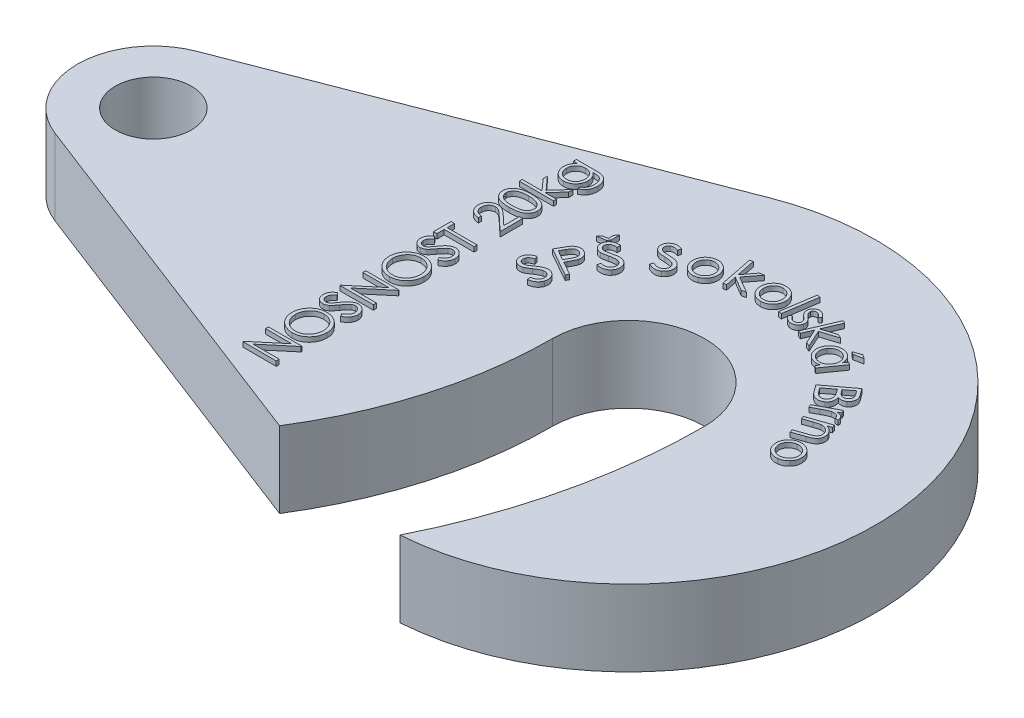
from build123d import *

# Parameters (mm, degrees)
SKETCH1_R           = 4
BOSS_EXTRUDE1_DEPTH = 8
BOSS_EXTRUDE2_DEPTH = 0.5


with BuildPart() as part:
    # Sketch1 → Boss-Extrude1 (new body)
    with BuildSketch(Plane(origin=(0, 0, 0), x_dir=(1, 0, 0), z_dir=(0, 1, 0))):
        with BuildLine():
            Line((-2.88, 7.463618425), (40.64, 24.256759883))
            ThreePointArc((40.64, 24.256759883), (75.371520283, 5.682073435), (51.88, -25.931941694))
            ThreePointArc((51.88, -25.931941694), (56.44926926, -13.322161987), (58, 0))
            ThreePointArc((58, 0), (50, 8), (42, 0))
            ThreePointArc((42, 0), (40.364821154, -11.60522353), (35.586608897, -22.306798678))
            Line((35.586608897, -22.306798678), (-2.88, -7.463618425))
            ThreePointArc((-2.88, -7.463618425), (-8, 0), (-2.88, 7.463618425))
        make_face()
        Circle(SKETCH1_R, mode=Mode.SUBTRACT)
    extrude(amount=BOSS_EXTRUDE1_DEPTH)

    # Sketch2 → Boss-Extrude2 (add)
    # profile 1 of 28: a face of its own
    with BuildSketch(Plane(origin=(0, 8, 0), x_dir=(1, 0, 0), z_dir=(0, 1, 0))):
        with BuildLine():
            add(Edge.make_bspline(
                [(66.457122944, 1.919207281), (66.462065136, 1.871122242), (66.471789856, 1.776505625), (66.469520637, 1.635405615), (66.452414495, 1.499002136), (66.422682678, 1.366841142), (66.377032896, 1.239843826), (66.318015617, 1.117164119), (66.243918618, 0.999420051), (66.185356622, 0.926341523), (66.155640572, 0.889259364)],
                knots=[0, 0, 0, 0, 1.047366529, 2.060896285, 3.051403264, 4.023675204, 4.991686196, 5.970721345, 6.970285313, 8, 8, 8, 8], degree=3))
            add(Edge.make_bspline(
                [(66.155640572, 0.889259364), (66.126578822, 0.856864489), (66.069307134, 0.793024246), (65.973379539, 0.708639299), (65.872438483, 0.633992737), (65.765369209, 0.5698622), (65.652330665, 0.516395267), (65.533747465, 0.47269723), (65.408717643, 0.440213242), (65.322848909, 0.426946652), (65.279238329, 0.420208884)],
                knots=[0, 0, 0, 0, 1.025628189, 2.021194787, 3.006747732, 3.983211479, 4.95953521, 5.951739431, 6.959739723, 8, 8, 8, 8], degree=3))
            add(Edge.make_bspline(
                [(65.279238329, 0.420208884), (65.235118697, 0.415560212), (65.148197181, 0.406401714), (65.018059005, 0.408528568), (64.890827351, 0.421592637), (64.766147212, 0.447015081), (64.643974765, 0.48436364), (64.524760472, 0.534319488), (64.408219331, 0.596695502), (64.295935294, 0.670173678), (64.190253716, 0.753644392), (64.095332535, 0.846467554), (64.011489293, 0.947360932), (63.940879374, 1.057490855), (63.880740177, 1.174993867), (63.833116728, 1.301105582), (63.796098444, 1.435095364), (63.781869855, 1.528259609), (63.774630957, 1.575657602)],
                knots=[0, 0, 0, 0, 1.006275062, 1.982495091, 2.948017846, 3.906269322, 4.866178864, 5.843565854, 6.83564391, 7.862723332, 8.885972839, 9.887650325, 10.871237724, 11.857168769, 12.851301538, 13.862195029, 14.912376043, 16, 16, 16, 16], degree=3))
            add(Edge.make_bspline(
                [(63.774630957, 1.575657602), (63.769716991, 1.623512977), (63.760072849, 1.717433879), (63.761886508, 1.856988678), (63.776367338, 1.991596361), (63.804384793, 2.121169389), (63.846076157, 2.245522079), (63.901174102, 2.364656341), (63.969428469, 2.478755133), (64.050816276, 2.585941673), (64.141101395, 2.685239298), (64.238077331, 2.774878458), (64.341106788, 2.85296452), (64.449114681, 2.920920997), (64.56365464, 2.976316302), (64.683557365, 3.021294855), (64.808970541, 3.056427747), (64.895543733, 3.069478171), (64.939194258, 3.076058243)],
                knots=[0, 0, 0, 0, 1.090029445, 2.139290452, 3.157503828, 4.155298219, 5.138935364, 6.125252258, 7.125814773, 8.14746951, 9.171553739, 10.165358093, 11.137220574, 12.09884446, 13.053919785, 14.016477626, 14.999900647, 16, 16, 16, 16], degree=3))
            add(Edge.make_bspline(
                [(64.939194258, 3.076058243), (64.982848015, 3.08057733), (65.068833649, 3.089478662), (65.197497119, 3.089218962), (65.323121983, 3.077530436), (65.445643617, 3.053485181), (65.565021273, 3.018006786), (65.681650725, 2.971838014), (65.795229243, 2.913400593), (65.866942757, 2.866381095), (65.903236726, 2.842584685)],
                knots=[0, 0, 0, 0, 1.036635882, 2.041881351, 3.035005606, 4.014240192, 4.987678545, 5.974361777, 6.974831273, 8, 8, 8, 8], degree=3))
            add(Edge.make_bspline(
                [(65.903236726, 2.842584685), (65.941803373, 2.814466093), (66.017676708, 2.759147533), (66.11799767, 2.662322057), (66.207263985, 2.559096245), (66.283574651, 2.447029543), (66.345889519, 2.326148378), (66.396575699, 2.197991441), (66.435147853, 2.061755955), (66.449706157, 1.967318716), (66.457122944, 1.919207281)],
                knots=[0, 0, 0, 0, 1.030207014, 2.026757531, 3.004449892, 3.975074505, 4.948545473, 5.936912399, 6.948951635, 8, 8, 8, 8], degree=3))
        make_face()
        with BuildLine():
            add(Edge.make_bspline(
                [(66.136009162, 1.877841095), (66.130894787, 1.911182369), (66.120805713, 1.976954357), (66.093170726, 2.072031815), (66.05890179, 2.163077031), (66.012961388, 2.248237369), (65.959804928, 2.329428149), (65.89686854, 2.405423056), (65.82495398, 2.476518641), (65.744835331, 2.541577757), (65.659503533, 2.600200401), (65.569941579, 2.64987828), (65.477107529, 2.688768449), (65.382092552, 2.719756963), (65.283883248, 2.738924311), (65.183252458, 2.749614334), (65.079631149, 2.750581238), (65.010197811, 2.743244247), (64.97495147, 2.739519781)],
                knots=[0, 0, 0, 0, 1.006213123, 1.984946316, 2.950453455, 3.905717003, 4.867686733, 5.844327762, 6.846078075, 7.88261738, 8.922065681, 9.934070285, 10.934726121, 11.92348441, 12.913005867, 13.91643206, 14.942321503, 16, 16, 16, 16], degree=3))
            add(Edge.make_bspline(
                [(64.97495147, 2.739519781), (64.929579937, 2.732045031), (64.840035215, 2.717292953), (64.710634483, 2.674698421), (64.588201413, 2.61651312), (64.474521736, 2.542164708), (64.371666421, 2.455708124), (64.282059368, 2.358374375), (64.208742066, 2.249881459), (64.150625765, 2.132878123), (64.108393381, 2.0090895), (64.083000054, 1.880863078), (64.074946122, 1.748713965), (64.082694219, 1.660455654), (64.086630155, 1.615621544)],
                knots=[0, 0, 0, 0, 1.03615041, 2.044934257, 3.061405234, 4.086590923, 5.100597392, 6.085889562, 7.061327499, 8.044614314, 9.025041373, 10.003254186, 10.985678288, 12, 12, 12, 12], degree=3))
            add(Edge.make_bspline(
                [(64.086630155, 1.615621544), (64.093857497, 1.571184424), (64.108081628, 1.48372772), (64.14981705, 1.358016184), (64.207085981, 1.240467643), (64.278271112, 1.130816835), (64.364295634, 1.032302226), (64.462828292, 0.946339198), (64.573754169, 0.873970226), (64.695309589, 0.816414465), (64.824102007, 0.773634798), (64.957269405, 0.748515318), (65.093090064, 0.739013789), (65.183687438, 0.747534628), (65.229458681, 0.751839493)],
                knots=[0, 0, 0, 0, 1.014295166, 1.99623454, 2.974728974, 3.957333258, 4.936310429, 5.915287601, 6.897891885, 7.914212688, 8.941156654, 9.950273553, 10.964445408, 12, 12, 12, 12], degree=3))
            add(Edge.make_bspline(
                [(65.229458681, 0.751839493), (65.264406327, 0.757279418), (65.333318509, 0.768006239), (65.43340678, 0.794939955), (65.528262978, 0.830684606), (65.617901076, 0.875220675), (65.702645703, 0.928009222), (65.781974186, 0.989912513), (65.855861668, 1.060639772), (65.924062249, 1.138433015), (65.984550415, 1.222164574), (66.036874629, 1.308873596), (66.078389719, 1.39854177), (66.110236403, 1.490120901), (66.132037562, 1.583895611), (66.144190456, 1.679975775), (66.145477978, 1.778482692), (66.139190635, 1.844457192), (66.136009162, 1.877841095)],
                knots=[0, 0, 0, 0, 1.056700853, 2.083675701, 3.091896039, 4.082337798, 5.070979178, 6.071594414, 7.084620256, 8.12434835, 9.159866383, 10.168715876, 11.147059274, 12.108163453, 13.062259156, 14.019801794, 14.99799551, 16, 16, 16, 16], degree=3))
        make_face(mode=Mode.SUBTRACT)
    # profile 2 of 28: a face of its own
    with BuildSketch(Plane(origin=(0, 8, 0), x_dir=(1, 0, 0), z_dir=(0, 1, 0))):
        with BuildLine():
            Line((65.224546357, 6.444109125), (65.333220235, 6.130707683))
            Line((65.333220235, 6.130707683), (64.897122479, 5.979966497))
            add(Edge.make_bspline(
                [(64.897122479, 5.979966497), (64.947782626, 5.962545229), (65.046121336, 5.928728017), (65.183335694, 5.861941531), (65.306770035, 5.784902974), (65.416204903, 5.696816414), (65.511897105, 5.598463175), (65.593869119, 5.489949009), (65.66145055, 5.370272419), (65.694421146, 5.284459246), (65.711124883, 5.240984125)],
                knots=[0, 0, 0, 0, 1.12421573, 2.182266144, 3.19676536, 4.17407521, 5.12510149, 6.071379274, 7.022912011, 8, 8, 8, 8], degree=3))
            add(Edge.make_bspline(
                [(65.711124883, 5.240984125), (65.724824413, 5.196190286), (65.751709032, 5.10828469), (65.769061299, 4.972736184), (65.766383633, 4.838982923), (65.743578651, 4.708477237), (65.703648902, 4.583556361), (65.643902948, 4.467999482), (65.569574195, 4.360792863), (65.491749975, 4.28099805), (65.419732075, 4.220704168), (65.355530804, 4.175971096), (65.281886924, 4.131896334), (65.199627163, 4.087285201), (65.107991254, 4.042905313), (65.006711848, 3.999732657), (64.896273897, 3.956458081), (64.819136919, 3.928756028), (64.779334017, 3.914461689)],
                knots=[0, 0, 0, 0, 1.215514486, 2.385384415, 3.533470766, 4.679676206, 5.81664129, 6.927517066, 8.047963619, 9.194764211, 9.811392972, 10.487045185, 11.225503818, 12.040757748, 12.91809451, 13.870246867, 14.901041295, 16, 16, 16, 16], degree=3))
            Line((64.779334017, 3.914461689), (63.527831614, 3.48116842))
            Line((63.527831614, 3.48116842), (63.420559979, 3.791765375))
            Line((63.420559979, 3.791765375), (64.580215428, 4.193508163))
            add(Edge.make_bspline(
                [(64.580215428, 4.193508163), (64.613650499, 4.205384362), (64.677810718, 4.228174189), (64.769341428, 4.261447266), (64.851698729, 4.293382072), (64.925224774, 4.322189837), (64.989109569, 4.350450702), (65.04386486, 4.376291519), (65.089719531, 4.399754472), (65.116420199, 4.416090101), (65.128492671, 4.423476112)],
                knots=[0, 0, 0, 0, 1.429904982, 2.743915734, 3.924549198, 4.989648275, 5.925855879, 6.738943362, 7.4298243, 8, 8, 8, 8], degree=3))
            add(Edge.make_bspline(
                [(65.128492671, 4.423476112), (65.146452689, 4.435114429), (65.181605969, 4.457894194), (65.229812048, 4.496029196), (65.273755879, 4.535245591), (65.312344187, 4.576668941), (65.346025349, 4.619787752), (65.376124228, 4.663766814), (65.399749904, 4.710719223), (65.426278954, 4.775153403), (65.446688363, 4.861741436), (65.452057236, 4.971388298), (65.437560282, 5.087262946), (65.414128024, 5.163920141), (65.401930171, 5.20382467)],
                knots=[0, 0, 0, 0, 0.850549713, 1.664787428, 2.44118319, 3.190753669, 3.912083628, 4.615716978, 5.305654952, 5.997655151, 7.38383778, 8.816887867, 10.343004994, 12, 12, 12, 12], degree=3))
            add(Edge.make_bspline(
                [(65.401930171, 5.20382467), (65.393190664, 5.226885244), (65.375854216, 5.272630208), (65.34335011, 5.338176072), (65.3054637, 5.39980338), (65.26259872, 5.457800344), (65.213948549, 5.511060276), (65.160230575, 5.560566195), (65.101142118, 5.605984377), (65.037886397, 5.647727428), (64.971529775, 5.684672741), (64.903517816, 5.716574919), (64.833910712, 5.741594824), (64.763421713, 5.761483177), (64.691663649, 5.775539871), (64.618765508, 5.78378527), (64.544655959, 5.787117548), (64.495136927, 5.783882985), (64.470139306, 5.782250151)],
                knots=[0, 0, 0, 0, 1.003573898, 1.990776667, 2.973153132, 3.945572432, 4.922264897, 5.90537833, 6.915964026, 7.953076471, 8.988135528, 10.005551243, 11.007861421, 11.995935001, 12.984924397, 13.981028261, 14.980806207, 16, 16, 16, 16], degree=3))
            add(Edge.make_bspline(
                [(64.470139306, 5.782250151), (64.45235316, 5.780079329), (64.413585445, 5.775347679), (64.351121879, 5.763802541), (64.279791735, 5.747653205), (64.199784421, 5.726144505), (64.11060346, 5.701096026), (64.012812778, 5.670686437), (63.905888519, 5.636433379), (63.832072098, 5.611082494), (63.793556774, 5.597855119)],
                knots=[0, 0, 0, 0, 0.612059536, 1.334080445, 2.168957353, 3.110191508, 4.164188008, 5.333569726, 6.608731952, 8, 8, 8, 8], degree=3))
            Line((63.793556774, 5.597855119), (62.901729851, 5.288660407))
            Line((62.901729851, 5.288660407), (62.793055973, 5.602061849))
            Line((62.793055973, 5.602061849), (65.224546357, 6.444109125))
        make_face()
    # profile 3 of 28: a face of its own
    with BuildSketch(Plane(origin=(0, 8, 0), x_dir=(1, 0, 0), z_dir=(0, 1, 0))):
        with BuildLine():
            Line((64.353405497, 8.254326436), (64.512560144, 7.957050795))
            Line((64.512560144, 7.957050795), (64.181630657, 7.779666981))
            add(Edge.make_bspline(
                [(64.181630657, 7.779666981), (64.224301777, 7.774391938), (64.306776574, 7.764196327), (64.423524803, 7.736538273), (64.529637757, 7.701908798), (64.6237872, 7.657478295), (64.707743067, 7.60595964), (64.779027573, 7.544532108), (64.840898174, 7.476761005), (64.871664152, 7.424793183), (64.886959183, 7.398957846)],
                knots=[0, 0, 0, 0, 1.235630112, 2.388227538, 3.444527833, 4.439703926, 5.375822793, 6.267380482, 7.138643724, 8, 8, 8, 8], degree=3))
            add(Edge.make_bspline(
                [(64.886959183, 7.398957846), (64.896956215, 7.377704559), (64.917397703, 7.33424678), (64.93654768, 7.261773389), (64.947804532, 7.182683088), (64.948367142, 7.127431839), (64.948657901, 7.098877718)],
                knots=[0, 0, 0, 0, 0.909264429, 1.859223552, 2.893636036, 4, 4, 4, 4], degree=3))
            Line((64.948657901, 7.098877718), (64.621234023, 7.11921025))
            add(Edge.make_bspline(
                [(64.621234023, 7.11921025), (64.619371628, 7.137004047), (64.615824474, 7.170894466), (64.607084477, 7.218410585), (64.594752165, 7.25970297), (64.583190748, 7.28385583), (64.577764471, 7.29519182)],
                knots=[0, 0, 0, 0, 1.176479166, 2.240745546, 3.174305223, 4, 4, 4, 4], degree=3))
            add(Edge.make_bspline(
                [(64.577764471, 7.29519182), (64.563263681, 7.318577247), (64.533904643, 7.365924568), (64.471313198, 7.425170884), (64.39580191, 7.475486226), (64.322563534, 7.508091799), (64.257638365, 7.52799812), (64.205016844, 7.540290734), (64.149088024, 7.54696816), (64.090278204, 7.549723597), (64.028434895, 7.548224004), (63.963605138, 7.542414727), (63.895697293, 7.532718338), (63.849718333, 7.523084342), (63.826161907, 7.518148551)],
                knots=[0, 0, 0, 0, 1.172635889, 2.37417815, 3.649331028, 5.040659107, 5.783577679, 6.552204852, 7.348096506, 8.188612922, 9.068384404, 9.991377961, 10.970921532, 12, 12, 12, 12], degree=3))
            add(Edge.make_bspline(
                [(63.826161907, 7.518148551), (63.805493504, 7.513117402), (63.759816847, 7.501998689), (63.687311695, 7.475476676), (63.602964139, 7.442763829), (63.507541525, 7.400852628), (63.400275257, 7.351013831), (63.281626324, 7.292852459), (63.15125903, 7.226810897), (63.061376332, 7.178754666), (63.014262869, 7.153565218)],
                knots=[0, 0, 0, 0, 0.572012491, 1.26413334, 2.074619762, 3.006925173, 4.067680292, 5.257411305, 6.562427966, 8, 8, 8, 8], degree=3))
            Line((63.014262869, 7.153565218), (62.247936747, 6.742707846))
            Line((62.247936747, 6.742707846), (62.0887821, 7.039983487))
            Line((62.0887821, 7.039983487), (64.353405497, 8.254326436))
        make_face()
    # profile 4 of 28: a face of its own
    with BuildSketch(Plane(origin=(0, 8, 0), x_dir=(1, 0, 0), z_dir=(0, 1, 0))):
        with BuildLine():
            Line((63.33580129, 11.212731639), (63.746658662, 10.666557761))
            add(Edge.make_bspline(
                [(63.746658662, 10.666557761), (63.766485221, 10.639585746), (63.804856794, 10.587385128), (63.857513476, 10.509151766), (63.904800238, 10.434385193), (63.945431764, 10.361917319), (63.980792911, 10.292667351), (64.009775824, 10.225985443), (64.032152384, 10.162147436), (64.054706525, 10.082280497), (64.070797762, 9.984174194), (64.07120914, 9.867188169), (64.055137005, 9.751570932), (64.021138874, 9.639120439), (63.97227357, 9.531884678), (63.90867225, 9.432672546), (63.830103343, 9.343061016), (63.768237234, 9.292683161), (63.736842957, 9.267118658)],
                knots=[0, 0, 0, 0, 1.012083872, 1.958748897, 2.850881501, 3.686210061, 4.469969365, 5.201152423, 5.882816942, 6.513768686, 7.709220678, 8.875236439, 10.038508023, 11.225723298, 12.414703887, 13.590825918, 14.777452171, 16, 16, 16, 16], degree=3))
            add(Edge.make_bspline(
                [(63.736842957, 9.267118658), (63.705844938, 9.245416899), (63.644837425, 9.202705449), (63.54450907, 9.154745828), (63.440116392, 9.121838374), (63.332186362, 9.102425363), (63.221670819, 9.099109145), (63.109647471, 9.111319314), (62.996453893, 9.139258649), (62.923644872, 9.170036732), (62.88638222, 9.18578853)],
                knots=[0, 0, 0, 0, 1.008489443, 1.984818199, 2.953306437, 3.922296602, 4.901986225, 5.893103891, 6.921719664, 8, 8, 8, 8], degree=3))
            add(Edge.make_bspline(
                [(62.88638222, 9.18578853), (62.899901241, 9.142507147), (62.925682832, 9.059966934), (62.952171467, 8.939006203), (62.965102521, 8.82764901), (62.96641775, 8.725072775), (62.955226416, 8.629000007), (62.93523141, 8.536667501), (62.903727421, 8.447068387), (62.863355213, 8.360493633), (62.813526158, 8.27782363), (62.753494855, 8.201606623), (62.685144717, 8.130221809), (62.633101682, 8.089108841), (62.606634624, 8.068200389)],
                knots=[0, 0, 0, 0, 1.313657354, 2.505223917, 3.582244926, 4.557548685, 5.470769532, 6.379483728, 7.289786608, 8.216940289, 9.143846565, 10.080010315, 11.023568125, 12, 12, 12, 12], degree=3))
            add(Edge.make_bspline(
                [(62.606634624, 8.068200389), (62.578721371, 8.048465713), (62.523801265, 8.009637185), (62.436058902, 7.961881084), (62.346054597, 7.923461736), (62.25301269, 7.896261419), (62.157649803, 7.878583507), (62.059884617, 7.870707645), (61.959606391, 7.874006067), (61.857872116, 7.886314741), (61.756319982, 7.909410384), (61.657148884, 7.943198691), (61.561050303, 7.987503041), (61.469243982, 8.04354676), (61.380008344, 8.109137954), (61.294954133, 8.186000546), (61.211936845, 8.272383886), (61.161985384, 8.336711132), (61.13638222, 8.369682761)],
                knots=[0, 0, 0, 0, 0.974844802, 1.918034459, 2.844571287, 3.762547307, 4.678218833, 5.608157917, 6.555582421, 7.53668103, 8.528466369, 9.521842564, 10.521467873, 11.541727072, 12.586179202, 13.67728699, 14.809468219, 16, 16, 16, 16], degree=3))
            Line((61.13638222, 8.369682761), (60.564266835, 9.13110103))
            Line((60.564266835, 9.13110103), (63.33580129, 11.212731639))
        make_face()
        with BuildLine():
            Line((63.268493598, 10.737371062), (62.381574528, 10.071305357))
            Line((62.381574528, 10.071305357), (62.500765233, 9.912851831))
            add(Edge.make_bspline(
                [(62.500765233, 9.912851831), (62.518412794, 9.889857769), (62.552550648, 9.845377519), (62.6038886, 9.782383758), (62.652357891, 9.724555295), (62.700488578, 9.674152394), (62.745956917, 9.6291142), (62.789234294, 9.589768097), (62.830612828, 9.55628162), (62.883573332, 9.521264054), (62.949659736, 9.486347665), (63.032208973, 9.457873809), (63.117078229, 9.442332207), (63.20329551, 9.439658967), (63.288716619, 9.449131042), (63.370788495, 9.472126548), (63.449354495, 9.506260531), (63.496370968, 9.5387937), (63.520196323, 9.555279716)],
                knots=[0, 0, 0, 0, 1.135182725, 2.195923937, 3.182806342, 4.089327269, 4.924305911, 5.68904857, 6.379516861, 7.006582325, 8.173430331, 9.296592349, 10.413320428, 11.539797209, 12.663854059, 13.765322064, 14.867588496, 16, 16, 16, 16], degree=3))
            add(Edge.make_bspline(
                [(63.520196323, 9.555279716), (63.535413933, 9.567370179), (63.564875882, 9.590777836), (63.603955126, 9.630154494), (63.637890681, 9.671128427), (63.66514939, 9.715324443), (63.688322348, 9.760954232), (63.704020849, 9.8095396), (63.714814291, 9.860042109), (63.719690703, 9.912745812), (63.718286095, 9.968075314), (63.709554993, 10.025658656), (63.694147766, 10.085703423), (63.670109974, 10.147388749), (63.641060124, 10.212268536), (63.603206175, 10.278445184), (63.559799612, 10.34787439), (63.526355922, 10.393336176), (63.508978374, 10.416958402)],
                knots=[0, 0, 0, 0, 0.951536344, 1.842215372, 2.713169377, 3.5519114, 4.38153639, 5.214395183, 6.045362546, 6.907920342, 7.801392165, 8.750375711, 9.755784233, 10.831995798, 11.990076698, 13.235764815, 14.563686275, 16, 16, 16, 16], degree=3))
            Line((63.508978374, 10.416958402), (63.268493598, 10.737371062))
        make_face(mode=Mode.SUBTRACT)
        with BuildLine():
            Line((62.102528053, 9.86166994), (61.039627412, 9.063793338))
            Line((61.039627412, 9.063793338), (61.296939111, 8.72094478))
            add(Edge.make_bspline(
                [(61.296939111, 8.72094478), (61.315488554, 8.69652544), (61.351216348, 8.64949173), (61.405341902, 8.583195453), (61.457966949, 8.524002597), (61.50761211, 8.47007543), (61.556032222, 8.423267664), (61.601994287, 8.382324372), (61.646363989, 8.348435046), (61.702193961, 8.312066015), (61.772839687, 8.27646424), (61.861475681, 8.248510368), (61.952758547, 8.232713361), (62.045852229, 8.230712981), (62.137797539, 8.242096132), (62.226236037, 8.264743223), (62.309152441, 8.301697314), (62.358680446, 8.335696163), (62.383677893, 8.352855838)],
                knots=[0, 0, 0, 0, 1.13288605, 2.182034221, 3.160783976, 4.058778145, 4.889185082, 5.647812881, 6.331657991, 6.949528533, 8.107922681, 9.241104812, 10.370992801, 11.519628203, 12.667679339, 13.78392633, 14.881517944, 16, 16, 16, 16], degree=3))
            add(Edge.make_bspline(
                [(62.383677893, 8.352855838), (62.41249694, 8.37660519), (62.469278043, 8.423397661), (62.536264111, 8.510712708), (62.586457902, 8.608045882), (62.61838783, 8.715018829), (62.632266674, 8.829008189), (62.627275066, 8.947469202), (62.601466753, 9.068796677), (62.570643631, 9.147376905), (62.554751611, 9.187891895)],
                knots=[0, 0, 0, 0, 0.968136727, 1.907484028, 2.8366992, 3.801456398, 4.793076217, 5.808490207, 6.870084733, 8, 8, 8, 8], degree=3))
            add(Edge.make_bspline(
                [(62.554751611, 9.187891895), (62.547904219, 9.202929488), (62.533255492, 9.235099635), (62.505988661, 9.285229961), (62.472827835, 9.341080251), (62.434665228, 9.403443342), (62.389415276, 9.470784008), (62.337944348, 9.54357769), (62.281416459, 9.622767905), (62.241201043, 9.677102783), (62.220316515, 9.70531978)],
                knots=[0, 0, 0, 0, 0.642348746, 1.374186241, 2.217396768, 3.168192859, 4.216723969, 5.371449293, 6.634950302, 8, 8, 8, 8], degree=3))
            Line((62.220316515, 9.70531978), (62.102528053, 9.86166994))
        make_face(mode=Mode.SUBTRACT)
    # profile 5 of 28: a face of its own
    with BuildSketch(Plane(origin=(0, 8, 0), x_dir=(1, 0, 0), z_dir=(0, 1, 0))):
        with BuildLine():
            Line((60.503690596, 12.743219711), (59.029231462, 10.645463301))
            Line((59.029231462, 10.645463301), (58.763506301, 10.83266282))
            Line((58.763506301, 10.83266282), (59.016611269, 11.193039423))
            add(Edge.make_bspline(
                [(59.016611269, 11.193039423), (58.965176002, 11.180273489), (58.864326818, 11.155243308), (58.711930577, 11.136705325), (58.563149504, 11.133305858), (58.41789724, 11.147303386), (58.276758896, 11.178479401), (58.140108475, 11.225770854), (58.007492252, 11.289143844), (57.924866224, 11.343044863), (57.882897327, 11.370423237)],
                knots=[0, 0, 0, 0, 1.070025633, 2.098000419, 3.09460413, 4.071990942, 5.039055622, 6.008297068, 6.98833845, 8, 8, 8, 8], degree=3))
            add(Edge.make_bspline(
                [(57.882897327, 11.370423237), (57.847047752, 11.397077752), (57.776413679, 11.449594886), (57.681257334, 11.539451664), (57.597732784, 11.636482159), (57.5245751, 11.740221378), (57.463568778, 11.851909943), (57.412807108, 11.970343841), (57.37445899, 12.096477908), (57.346479693, 12.227550542), (57.331234325, 12.361398965), (57.328369556, 12.494230758), (57.337639835, 12.624989685), (57.362306713, 12.752756556), (57.397676284, 12.878462614), (57.447547466, 13.000738553), (57.509144194, 13.121082266), (57.559829579, 13.196851016), (57.585621686, 13.235407211)],
                knots=[0, 0, 0, 0, 1.019777959, 2.0092587, 2.982051689, 3.940277749, 4.903176773, 5.883847938, 6.87842798, 7.909752458, 8.941449926, 9.950651074, 10.941096227, 11.929510701, 12.917997256, 13.919245842, 14.941173438, 16, 16, 16, 16], degree=3))
            add(Edge.make_bspline(
                [(57.585621686, 13.235407211), (57.612722841, 13.271980319), (57.666129272, 13.344052492), (57.757429629, 13.440698693), (57.854470149, 13.527404701), (57.95974823, 13.601662107), (58.071344854, 13.666162285), (58.190886918, 13.71780395), (58.316804817, 13.759510532), (58.448350503, 13.789037099), (58.581804257, 13.807552625), (58.714034445, 13.812424388), (58.843194074, 13.804781037), (58.969454895, 13.784557231), (59.092544861, 13.750656357), (59.212380738, 13.703802254), (59.329810032, 13.645117411), (59.403411885, 13.596124952), (59.440789955, 13.571244551)],
                knots=[0, 0, 0, 0, 1.041808458, 2.053022152, 3.039027389, 4.017871979, 4.998544504, 5.986132334, 6.995033902, 8.032611746, 9.069775249, 10.076843211, 11.05821676, 12.02890374, 13.0002842, 13.97647587, 14.972370612, 16, 16, 16, 16], degree=3))
            add(Edge.make_bspline(
                [(59.440789955, 13.571244551), (59.482076412, 13.540470586), (59.5631625, 13.4800309), (59.668492445, 13.37331222), (59.759563889, 13.258637199), (59.833356217, 13.13332538), (59.891984506, 12.999440687), (59.934211735, 12.856038998), (59.960505817, 12.703505006), (59.964561519, 12.598427412), (59.966631301, 12.544802243)],
                knots=[0, 0, 0, 0, 1.027786225, 2.01855939, 2.986535701, 3.947738871, 4.91612074, 5.900310914, 6.928447281, 8, 8, 8, 8], degree=3))
            Line((59.966631301, 12.544802243), (60.237965436, 12.930419231))
            Line((60.237965436, 12.930419231), (60.503690596, 12.743219711))
        make_face()
        with BuildLine():
            add(Edge.make_bspline(
                [(59.278830821, 13.296404807), (59.240865977, 13.3210549), (59.165919289, 13.369716836), (59.043802945, 13.424029291), (58.916290414, 13.460490799), (58.784850288, 13.480914735), (58.651359082, 13.483895244), (58.518529307, 13.468310798), (58.387617933, 13.434261433), (58.261131244, 13.38208964), (58.140731315, 13.316374788), (58.031508454, 13.235596985), (57.933141683, 13.142862961), (57.878694761, 13.071454802), (57.851346846, 13.0355875)],
                knots=[0, 0, 0, 0, 1.009786637, 1.993427571, 2.97138785, 3.964291715, 4.95624846, 5.944242206, 6.941854527, 7.967356653, 8.992978326, 9.997286472, 10.994065486, 12, 12, 12, 12], degree=3))
            add(Edge.make_bspline(
                [(57.851346846, 13.0355875), (57.826878081, 12.997871192), (57.778170762, 12.922793426), (57.724429585, 12.798670745), (57.685401319, 12.667885825), (57.664236181, 12.531085846), (57.659297859, 12.393179831), (57.670592388, 12.257239464), (57.701595248, 12.125889733), (57.748022166, 11.999730981), (57.811473664, 11.882374934), (57.887425163, 11.774558111), (57.977675326, 11.678538827), (58.047549715, 11.625621757), (58.082717038, 11.598988942)],
                knots=[0, 0, 0, 0, 1.002090992, 1.994753893, 3.006642446, 4.041877164, 5.075480596, 6.081055576, 7.077003184, 8.078999112, 9.073292036, 10.046055767, 11.016592642, 12, 12, 12, 12], degree=3))
            add(Edge.make_bspline(
                [(58.082717038, 11.598988942), (58.120180854, 11.574479959), (58.194921565, 11.525584277), (58.3181899, 11.472685044), (58.447053201, 11.432819492), (58.581598478, 11.412064422), (58.717274191, 11.406410855), (58.850541198, 11.42006076), (58.979308863, 11.45083962), (59.102368245, 11.50036692), (59.218479378, 11.566667543), (59.326052147, 11.64852183), (59.425270637, 11.745344785), (59.481027828, 11.820186533), (59.509499891, 11.858404006)],
                knots=[0, 0, 0, 0, 0.99442001, 1.983878521, 2.972571514, 3.98905852, 5.003734933, 5.986337357, 6.960024126, 7.940146618, 8.927635456, 9.926071916, 10.940961508, 12, 12, 12, 12], degree=3))
            add(Edge.make_bspline(
                [(59.509499891, 11.858404006), (59.529678269, 11.888683775), (59.569344976, 11.948207819), (59.618550875, 12.041845625), (59.657426876, 12.13720211), (59.68639077, 12.233906361), (59.704637332, 12.332398495), (59.713280016, 12.432218965), (59.71086444, 12.533697236), (59.69882763, 12.635497084), (59.678328741, 12.735631451), (59.648027449, 12.831746008), (59.608428627, 12.922477041), (59.560855759, 13.008577356), (59.503430251, 13.089006945), (59.437301797, 13.164016273), (59.362566459, 13.234262716), (59.30707916, 13.275441083), (59.278830821, 13.296404807)],
                knots=[0, 0, 0, 0, 1.073995354, 2.111262767, 3.11731771, 4.110867192, 5.086810645, 6.070313917, 7.06434268, 8.078766333, 9.0939175, 10.078316307, 11.048876419, 12.012813318, 12.977960061, 13.960906238, 14.961906371, 16, 16, 16, 16], degree=3))
        make_face(mode=Mode.SUBTRACT)
    # profile 6 of 28: a face of its own
    with BuildSketch(Plane(origin=(0, 8, 0), x_dir=(1, 0, 0), z_dir=(0, 1, 0))):
        Polygon((60.303870885, 14.353696474), (60.718233865, 14.062029807), (59.732456622, 13.86781907), (59.466731462, 14.05501859), align=None)
    # profile 7 of 28: a face of its own
    with BuildSketch(Plane(origin=(0, 8, 0), x_dir=(1, 0, 0), z_dir=(0, 1, 0))):
        Polygon((56.162580055, 16.410629922), (56.468269157, 16.278819025), (55.666185824, 14.418041781), (57.166586465, 14.898310211), (57.613201048, 14.706202839), (55.833052811, 14.137593063), (56.672996722, 12.313274153), (56.243209061, 12.498370307), (55.51614576, 14.068883128), (55.05901435, 13.008085852), (54.753325247, 13.139896749), align=None)
    # profile 8 of 28: a face of its own
    with BuildSketch(Plane(origin=(0, 8, 0), x_dir=(1, 0, 0), z_dir=(0, 1, 0))):
        with BuildLine():
            Line((54.787135377, 15.568710487), (54.524214704, 15.408153596))
            add(Edge.make_bspline(
                [(54.524214704, 15.408153596), (54.508223414, 15.433642745), (54.477321969, 15.482897779), (54.426423418, 15.550423095), (54.374552047, 15.610536951), (54.320687882, 15.662864443), (54.264333382, 15.706248567), (54.207088224, 15.742633961), (54.14800897, 15.771538015), (54.106555626, 15.783591028), (54.086013582, 15.789563852)],
                knots=[0, 0, 0, 0, 1.211936413, 2.34193648, 3.403182761, 4.408828153, 5.361913974, 6.263261699, 7.13936607, 8, 8, 8, 8], degree=3))
            add(Edge.make_bspline(
                [(54.086013582, 15.789563852), (54.060418622, 15.79476324), (54.010249235, 15.804954703), (53.933967135, 15.803101821), (53.859889339, 15.787461163), (53.790317883, 15.757273815), (53.727612635, 15.716954122), (53.676684692, 15.666820881), (53.637492539, 15.60888823), (53.623857806, 15.564974787), (53.616963101, 15.542768981)],
                knots=[0, 0, 0, 0, 1.065718728, 2.088944587, 3.095960615, 4.145516093, 5.174443908, 6.127738026, 7.053249211, 8, 8, 8, 8], degree=3))
            add(Edge.make_bspline(
                [(53.616963101, 15.542768981), (53.612837436, 15.522283885), (53.604542431, 15.481096832), (53.607694538, 15.416534266), (53.621580615, 15.350522966), (53.63979311, 15.308102923), (53.649214704, 15.286158404)],
                knots=[0, 0, 0, 0, 0.947354144, 1.904737247, 2.916089398, 4, 4, 4, 4], degree=3))
            add(Edge.make_bspline(
                [(53.649214704, 15.286158404), (53.655293463, 15.274105411), (53.668150906, 15.24861161), (53.693660926, 15.210741531), (53.723523243, 15.168955007), (53.761086192, 15.125373016), (53.803802304, 15.078318004), (53.852601801, 15.02844208), (53.906863711, 14.975126871), (53.946336019, 14.939872659), (53.966822877, 14.92157507)],
                knots=[0, 0, 0, 0, 0.665751336, 1.408159168, 2.250433439, 3.200252131, 4.245601613, 5.387815086, 6.644227661, 8, 8, 8, 8], degree=3))
            add(Edge.make_bspline(
                [(53.966822877, 14.92157507), (53.991757113, 14.898844117), (54.039774764, 14.855069485), (54.106937417, 14.788678646), (54.166858969, 14.724434744), (54.22064353, 14.663000696), (54.266179223, 14.603251076), (54.305189737, 14.546023347), (54.337894454, 14.491337291), (54.354408627, 14.454094992), (54.362255569, 14.436398788)],
                knots=[0, 0, 0, 0, 1.284187713, 2.473052704, 3.59334473, 4.627695873, 5.5795763, 6.450536611, 7.263750625, 8, 8, 8, 8], degree=3))
            add(Edge.make_bspline(
                [(54.362255569, 14.436398788), (54.373944505, 14.401867452), (54.397008149, 14.333733067), (54.411052973, 14.226554947), (54.409974387, 14.117983751), (54.394595295, 14.046881691), (54.386794832, 14.010817859)],
                knots=[0, 0, 0, 0, 1.007998251, 1.988899065, 2.979945087, 4, 4, 4, 4], degree=3))
            add(Edge.make_bspline(
                [(54.386794832, 14.010817859), (54.3795383, 13.985661604), (54.365277623, 13.936224052), (54.336359002, 13.865629208), (54.301054055, 13.800282764), (54.260240433, 13.73900071), (54.212059735, 13.683475181), (54.159763499, 13.630762588), (54.099897176, 13.584548167), (54.035489933, 13.542846469), (53.96723436, 13.507265028), (53.896618627, 13.478757223), (53.824101014, 13.458746287), (53.750256323, 13.444805924), (53.674492302, 13.440388939), (53.597353241, 13.442622612), (53.518057405, 13.451229502), (53.465645324, 13.463821929), (53.438878166, 13.470252955)],
                knots=[0, 0, 0, 0, 1.031519871, 2.027162488, 2.999868105, 3.955453716, 4.922691087, 5.893300541, 6.877412133, 7.896974468, 8.914703955, 9.906888506, 10.892637197, 11.875627097, 12.863439826, 13.87715887, 14.91585255, 16, 16, 16, 16], degree=3))
            add(Edge.make_bspline(
                [(53.438878166, 13.470252955), (53.403510414, 13.480611504), (53.333164902, 13.501214382), (53.233239207, 13.547397287), (53.137626561, 13.602520122), (53.04959265, 13.669924758), (52.968667915, 13.744913648), (52.899323168, 13.828711459), (52.838213415, 13.917667647), (52.807719464, 13.982531693), (52.792443871, 14.01502459)],
                knots=[0, 0, 0, 0, 1.010482036, 2.00982172, 3.013395304, 4.034837709, 5.047049658, 6.035308813, 7.015810564, 8, 8, 8, 8], degree=3))
            Line((52.792443871, 14.01502459), (53.054663422, 14.193109525))
            add(Edge.make_bspline(
                [(53.054663422, 14.193109525), (53.069121213, 14.165707981), (53.097108312, 14.112664627), (53.146179919, 14.039987043), (53.19787315, 13.975365911), (53.252439389, 13.918763314), (53.310757598, 13.871296951), (53.371736381, 13.831474053), (53.436844835, 13.801071738), (53.482164182, 13.787114843), (53.504783614, 13.780148788)],
                knots=[0, 0, 0, 0, 1.179782921, 2.283799851, 3.335205211, 4.330188255, 5.273162239, 6.19452814, 7.098867241, 8, 8, 8, 8], degree=3))
            add(Edge.make_bspline(
                [(53.504783614, 13.780148788), (53.536187484, 13.773596672), (53.597632754, 13.760776704), (53.691303789, 13.761809692), (53.781808759, 13.780197967), (53.866690254, 13.816113804), (53.942249221, 13.865031577), (54.005295664, 13.924652896), (54.051712994, 13.995686235), (54.068929264, 14.04864749), (54.077600121, 14.075321064)],
                knots=[0, 0, 0, 0, 1.075837482, 2.104999297, 3.123400664, 4.162202081, 5.184142463, 6.134195067, 7.060300099, 8, 8, 8, 8], degree=3))
            add(Edge.make_bspline(
                [(54.077600121, 14.075321064), (54.08248968, 14.098121788), (54.092147944, 14.143159679), (54.090546008, 14.212385601), (54.078333464, 14.280875336), (54.060655967, 14.324003199), (54.051658614, 14.345954077)],
                knots=[0, 0, 0, 0, 1.006247906, 1.987624729, 2.975757204, 4, 4, 4, 4], degree=3))
            add(Edge.make_bspline(
                [(54.051658614, 14.345954077), (54.045544786, 14.357289709), (54.032164002, 14.38209898), (54.006012651, 14.419415531), (53.973171137, 14.460139984), (53.934997397, 14.505178067), (53.888731807, 14.552518857), (53.837104242, 14.604434103), (53.778784401, 14.659987322), (53.736965232, 14.697337102), (53.715120153, 14.716847506)],
                knots=[0, 0, 0, 0, 0.613988857, 1.343781864, 2.16908703, 3.109881546, 4.158630117, 5.325361828, 6.602849293, 8, 8, 8, 8], degree=3))
            add(Edge.make_bspline(
                [(53.715120153, 14.716847506), (53.691552922, 14.738140198), (53.645910566, 14.779377484), (53.582973593, 14.842532924), (53.526644618, 14.903627291), (53.476870619, 14.962599026), (53.432723706, 15.01896644), (53.397217265, 15.074796362), (53.367113011, 15.127937915), (53.351647959, 15.163787124), (53.344226723, 15.180990134)],
                knots=[0, 0, 0, 0, 1.272424125, 2.464287588, 3.571043008, 4.600973319, 5.556163922, 6.436694119, 7.249814172, 8, 8, 8, 8], degree=3))
            add(Edge.make_bspline(
                [(53.344226723, 15.180990134), (53.333081865, 15.214837839), (53.311001226, 15.281898262), (53.297190257, 15.387626144), (53.300468297, 15.495177036), (53.315545796, 15.565828798), (53.323193069, 15.601663211)],
                knots=[0, 0, 0, 0, 0.997786401, 1.976854288, 2.973865073, 4, 4, 4, 4], degree=3))
            add(Edge.make_bspline(
                [(53.323193069, 15.601663211), (53.329732765, 15.624727641), (53.342623916, 15.670192605), (53.369845784, 15.734720144), (53.401018062, 15.795470923), (53.438542102, 15.850927157), (53.480705565, 15.902030854), (53.528922967, 15.947580116), (53.581839989, 15.989288507), (53.639459431, 16.026238471), (53.701012665, 16.056725318), (53.764537801, 16.081586341), (53.829786715, 16.099935951), (53.896771491, 16.111172547), (53.96539348, 16.11542399), (54.035547729, 16.11225557), (54.107595043, 16.103288756), (54.155502353, 16.092399543), (54.179963903, 16.086839493)],
                knots=[0, 0, 0, 0, 1.043713169, 2.057383664, 3.045828208, 4.014614748, 4.969057688, 5.927025472, 6.898804741, 7.901675333, 8.903614803, 9.887010326, 10.870405849, 11.851478554, 12.841181328, 13.860361497, 14.907497092, 16, 16, 16, 16], degree=3))
            add(Edge.make_bspline(
                [(54.179963903, 16.086839493), (54.2084591, 16.078103604), (54.265970217, 16.060472184), (54.3491877, 16.02237764), (54.428873895, 15.972076774), (54.506858052, 15.9127973), (54.581311103, 15.841637945), (54.653575775, 15.760829953), (54.723261572, 15.669418488), (54.765429015, 15.602934287), (54.787135377, 15.568710487)],
                knots=[0, 0, 0, 0, 0.873773289, 1.763513923, 2.674891558, 3.633456031, 4.632601537, 5.691101505, 6.811457764, 8, 8, 8, 8], degree=3))
        make_face()
    # profile 9 of 28: a face of its own
    with BuildSketch(Plane(origin=(0, 8, 0), x_dir=(1, 0, 0), z_dir=(0, 1, 0))):
        Polygon((52.474477373, 17.392982777), (52.803303495, 17.342502008), (52.262037469, 13.807445918), (51.933211348, 13.857926687), align=None)
    # profile 10 of 28: a face of its own
    with BuildSketch(Plane(origin=(0, 8, 0), x_dir=(1, 0, 0), z_dir=(0, 1, 0))):
        with BuildLine():
            add(Edge.make_bspline(
                [(50.028592616, 16.550646425), (50.077046463, 16.549307232), (50.172287383, 16.546674915), (50.311809889, 16.525679592), (50.44530639, 16.492455082), (50.571903713, 16.444035087), (50.692850842, 16.383977867), (50.806376082, 16.308400467), (50.914139787, 16.220392609), (50.97883555, 16.152434521), (51.011565373, 16.118054277)],
                knots=[0, 0, 0, 0, 1.049267216, 2.062440488, 3.049729235, 4.023936231, 4.993038315, 5.968993548, 6.972506435, 8, 8, 8, 8], degree=3))
            add(Edge.make_bspline(
                [(51.011565373, 16.118054277), (51.040096959, 16.08519808), (51.096448055, 16.020305694), (51.167778044, 15.913889482), (51.228991206, 15.803982766), (51.279280726, 15.689519694), (51.318062305, 15.570441331), (51.344896537, 15.446619926), (51.362749292, 15.318595342), (51.364197686, 15.231663954), (51.364930757, 15.187665656)],
                knots=[0, 0, 0, 0, 1.023942051, 2.022329074, 3.010253829, 3.983768855, 4.961955873, 5.954149, 6.964540141, 8, 8, 8, 8], degree=3))
            add(Edge.make_bspline(
                [(51.364930757, 15.187665656), (51.363624034, 15.143439586), (51.361034922, 15.055811028), (51.343254309, 14.926631539), (51.31380379, 14.801672917), (51.272046114, 14.681357674), (51.219314757, 14.565003505), (51.154604728, 14.453136048), (51.077254605, 14.346075885), (50.98986767, 14.243987068), (50.893627252, 14.149706216), (50.788775812, 14.067799426), (50.677945299, 13.997836238), (50.559596545, 13.941585275), (50.435131352, 13.897234617), (50.303824882, 13.865512178), (50.165826214, 13.847315929), (50.071648083, 13.844863934), (50.023684764, 13.843615175)],
                knots=[0, 0, 0, 0, 1.002823046, 1.986971441, 2.951108401, 3.90982574, 4.870416377, 5.844004749, 6.835319574, 7.861442568, 8.888400137, 9.885013693, 10.873206706, 11.854611267, 12.850350712, 13.864579098, 14.912466471, 16, 16, 16, 16], degree=3))
            add(Edge.make_bspline(
                [(50.023684764, 13.843615175), (49.975466714, 13.844704792), (49.880718183, 13.846845891), (49.742487687, 13.867287416), (49.610835034, 13.898550289), (49.486025402, 13.943014125), (49.367667132, 13.99991693), (49.256256255, 14.06982368), (49.151919194, 14.152382039), (49.056052213, 14.246775853), (48.969246193, 14.349190675), (48.89214894, 14.456340634), (48.827953066, 14.568846379), (48.775520428, 14.685400041), (48.733312535, 14.805765908), (48.705107069, 14.930952665), (48.686788586, 15.059983767), (48.684829598, 15.147638373), (48.683841014, 15.191872386)],
                knots=[0, 0, 0, 0, 1.091453818, 2.144708171, 3.15766085, 4.152147843, 5.139381747, 6.1263318, 7.124965815, 8.146841176, 9.168236594, 10.162610884, 11.132334505, 12.096538203, 13.054049657, 14.01576561, 14.998676131, 16, 16, 16, 16], degree=3))
            add(Edge.make_bspline(
                [(48.683841014, 15.191872386), (48.684773505, 15.235882445), (48.686611471, 15.322627479), (48.705540592, 15.450042654), (48.731802176, 15.573432283), (48.772039505, 15.691615682), (48.821463343, 15.806199086), (48.884176094, 15.915188676), (48.955043386, 16.021753991), (49.01145079, 16.086615804), (49.040010886, 16.119456521)],
                knots=[0, 0, 0, 0, 1.037689197, 2.045313867, 3.03404923, 4.01062203, 4.986026355, 5.973746194, 6.974070786, 8, 8, 8, 8], degree=3))
            add(Edge.make_bspline(
                [(49.040010886, 16.119456521), (49.072899938, 16.154158346), (49.13771088, 16.222541528), (49.246872465, 16.309753354), (49.360832667, 16.385374778), (49.482342765, 16.445617064), (49.609947957, 16.492967607), (49.743959858, 16.526394994), (49.884187141, 16.54753837), (49.979904566, 16.549598507), (50.028592616, 16.550646425)],
                knots=[0, 0, 0, 0, 1.030230603, 2.03016544, 3.006163136, 3.975628852, 4.948627283, 5.936582439, 6.950412849, 8, 8, 8, 8], degree=3))
        make_face()
        with BuildLine():
            add(Edge.make_bspline(
                [(50.027891495, 16.226027034), (49.994193543, 16.225029764), (49.927440112, 16.223054237), (49.829143916, 16.208964079), (49.734572468, 16.184830345), (49.643511813, 16.151836575), (49.556164121, 16.108992859), (49.473133604, 16.055483961), (49.392755538, 15.993990083), (49.318060436, 15.922630801), (49.248922856, 15.845594488), (49.188119675, 15.763433551), (49.137628615, 15.676362822), (49.095146587, 15.586029672), (49.062822305, 15.491206315), (49.03974679, 15.39258217), (49.02537014, 15.289982628), (49.023453404, 15.220197654), (49.022482841, 15.184861168)],
                knots=[0, 0, 0, 0, 1.005333312, 1.991499383, 2.955524007, 3.912918084, 4.876564328, 5.851547976, 6.855792414, 7.891689345, 8.928852912, 9.941415464, 10.935268327, 11.927358257, 12.915297832, 13.918306783, 14.945908865, 16, 16, 16, 16], degree=3))
            add(Edge.make_bspline(
                [(49.022482841, 15.184861168), (49.024141356, 15.138952401), (49.027423306, 15.048105933), (49.052425301, 14.914248688), (49.095291553, 14.78569352), (49.153055465, 14.662828445), (49.225306753, 14.548773777), (49.311530145, 14.44783082), (49.409400551, 14.360528073), (49.518130876, 14.287579169), (49.63602383, 14.230200352), (49.760450711, 14.188693525), (49.89053711, 14.162337601), (49.979388678, 14.159270842), (50.024385886, 14.157717739)],
                knots=[0, 0, 0, 0, 1.033475407, 2.045090608, 3.053661949, 4.077781399, 5.095388963, 6.084675025, 7.057586189, 8.03996037, 9.023841876, 10.00078744, 10.987536346, 12, 12, 12, 12], degree=3))
            add(Edge.make_bspline(
                [(50.024385886, 14.157717739), (50.069384001, 14.15901025), (50.157976832, 14.161554963), (50.287741029, 14.187484696), (50.412086338, 14.227683552), (50.529213475, 14.286062516), (50.638819795, 14.357360108), (50.736527246, 14.445081784), (50.822565545, 14.546021355), (50.895698512, 14.659575691), (50.95527587, 14.781828042), (50.997204371, 14.910956957), (51.024638715, 15.044413926), (51.027598929, 15.135413609), (51.029093418, 15.181355559)],
                knots=[0, 0, 0, 0, 1.012695845, 1.993807751, 2.969620217, 3.949303817, 4.933674654, 5.907111476, 6.896932042, 7.91350859, 8.942717607, 9.951833872, 10.965966214, 12, 12, 12, 12], degree=3))
            add(Edge.make_bspline(
                [(51.029093418, 15.181355559), (51.028419157, 15.216694849), (51.027087393, 15.286495165), (51.012488071, 15.38907339), (50.989400092, 15.487920962), (50.957068185, 15.582832317), (50.915622986, 15.673943989), (50.864014781, 15.760426614), (50.803176099, 15.842835831), (50.73451218, 15.920587279), (50.659292933, 15.991536361), (50.580039112, 16.054394753), (50.496908592, 16.107370623), (50.409883108, 16.150436661), (50.319459504, 16.184237564), (50.225164531, 16.207997863), (50.12771691, 16.223299787), (50.061368804, 16.225112428), (50.027891495, 16.226027034)],
                knots=[0, 0, 0, 0, 1.054617061, 2.083024438, 3.086819412, 4.0821364, 5.072080882, 6.070256263, 7.083612324, 8.126807203, 9.16351593, 10.167335162, 11.143082871, 12.101227224, 13.061782964, 14.019800233, 15.000849267, 16, 16, 16, 16], degree=3))
        make_face(mode=Mode.SUBTRACT)
    # profile 11 of 28: a face of its own
    with BuildSketch(Plane(origin=(0, 8, 0), x_dir=(1, 0, 0), z_dir=(0, 1, 0))):
        Polygon((45.717105944, 17.009483729), (46.045230944, 17.076090299), (46.446973732, 15.083502158), (47.409613957, 16.336406806), (47.887779021, 16.432460492), (46.744950495, 14.948185652), (48.478824694, 13.921743344), (48.018888797, 13.829195267), (46.521993764, 14.709804242), (46.751260591, 13.573986934), (46.423135591, 13.507380363), align=None)
    # profile 12 of 28: a face of its own
    with BuildSketch(Plane(origin=(0, 8, 0), x_dir=(1, 0, 0), z_dir=(0, 1, 0))):
        with BuildLine():
            add(Edge.make_bspline(
                [(43.564651063, 15.235504304), (43.609699003, 15.252941449), (43.698066502, 15.287146719), (43.833750176, 15.323331445), (43.968965621, 15.343699484), (44.103673142, 15.349476974), (44.23793761, 15.340232398), (44.371408417, 15.316176408), (44.504577184, 15.27761709), (44.590272482, 15.24087303), (44.633861801, 15.22218299)],
                knots=[0, 0, 0, 0, 1.050843791, 2.061369284, 3.049104854, 4.021527813, 4.990271781, 5.972108644, 6.968503464, 8, 8, 8, 8], degree=3))
            add(Edge.make_bspline(
                [(44.633861801, 15.22218299), (44.672599718, 15.203057426), (44.7494414, 15.165119391), (44.856310159, 15.095853292), (44.955617103, 15.019241844), (45.045273548, 14.933220032), (45.127419043, 14.83930776), (45.200788784, 14.7369172), (45.266291945, 14.626100495), (45.301615012, 14.547146772), (45.319558916, 14.507038759)],
                knots=[0, 0, 0, 0, 1.021364836, 2.026009594, 3.007066696, 3.984799256, 4.960606851, 5.954973955, 6.961139152, 8, 8, 8, 8], degree=3))
            add(Edge.make_bspline(
                [(45.319558916, 14.507038759), (45.335802294, 14.46595606), (45.367898118, 14.384779403), (45.401348198, 14.259196159), (45.422290131, 14.133354565), (45.432133115, 14.006794736), (45.426988964, 13.879821582), (45.412168625, 13.751731384), (45.382647843, 13.623560723), (45.342592337, 13.495939153), (45.290549526, 13.372735749), (45.227112223, 13.256771229), (45.152592576, 13.149599802), (45.066469035, 13.051844833), (44.969839908, 12.962729694), (44.86154732, 12.883522254), (44.742862526, 12.811863234), (44.657207678, 12.773232378), (44.613529269, 12.75353315)],
                knots=[0, 0, 0, 0, 1.005877701, 1.987546832, 2.953977537, 3.909624958, 4.873940996, 5.844820871, 6.843413863, 7.865620635, 8.889227187, 9.885346898, 10.872086311, 11.856884241, 12.847995963, 13.860798096, 14.909145969, 16, 16, 16, 16], degree=3))
            add(Edge.make_bspline(
                [(44.613529269, 12.75353315), (44.568739995, 12.735786455), (44.481176388, 12.701091438), (44.346618767, 12.665458054), (44.213738513, 12.643352607), (44.081879159, 12.635491068), (43.951423374, 12.641849005), (43.822258419, 12.662139349), (43.694728956, 12.697684084), (43.57015202, 12.746871914), (43.450363275, 12.806506142), (43.338777836, 12.875996687), (43.236283158, 12.953750094), (43.14233117, 13.039418909), (43.058298192, 13.134528421), (42.982604017, 13.237550142), (42.916401795, 13.349165539), (42.88033474, 13.428584395), (42.862127025, 13.468677381)],
                knots=[0, 0, 0, 0, 1.095418553, 2.141557371, 3.160042582, 4.1561815, 5.141129415, 6.126421799, 7.124984951, 8.147059438, 9.169673304, 10.165698663, 11.133544457, 12.093292209, 13.053805732, 14.016377922, 14.998608933, 16, 16, 16, 16], degree=3))
            add(Edge.make_bspline(
                [(42.862127025, 13.468677381), (42.845857184, 13.509287145), (42.813801911, 13.58929758), (42.780805586, 13.713148349), (42.757541626, 13.836616728), (42.748224253, 13.960690912), (42.749318973, 14.084610701), (42.762789909, 14.208849693), (42.788732757, 14.333236833), (42.814665824, 14.414690997), (42.827772057, 14.455856868)],
                knots=[0, 0, 0, 0, 1.037222085, 2.043562504, 3.035605818, 4.014730456, 4.990835038, 5.972547613, 6.975352034, 8, 8, 8, 8], degree=3))
            add(Edge.make_bspline(
                [(42.827772057, 14.455856868), (42.844638912, 14.500408878), (42.877764152, 14.587905686), (42.942224079, 14.711079553), (43.018723148, 14.823508263), (43.104595399, 14.927726172), (43.204199652, 15.019550069), (43.313315775, 15.102808606), (43.433600825, 15.176572839), (43.520472996, 15.215638043), (43.564651063, 15.235504304)],
                knots=[0, 0, 0, 0, 1.032377048, 2.027511147, 3.005817167, 3.977194008, 4.948874869, 5.936131725, 6.950438206, 8, 8, 8, 8], degree=3))
        make_face()
        with BuildLine():
            add(Edge.make_bspline(
                [(43.690151865, 14.938228663), (43.659441513, 14.924376892), (43.599074457, 14.897148594), (43.514984585, 14.845670799), (43.437393969, 14.78780265), (43.367805284, 14.72100216), (43.304415644, 14.647961589), (43.247774473, 14.567644317), (43.19964831, 14.479056144), (43.157811603, 14.384969886), (43.125328101, 14.286959595), (43.101801381, 14.187999889), (43.08811303, 14.088890582), (43.085903546, 13.989546599), (43.091445762, 13.889818892), (43.109943977, 13.79051074), (43.136039866, 13.690425092), (43.161738786, 13.625726951), (43.174827346, 13.592775938)],
                knots=[0, 0, 0, 0, 1.008717586, 1.982826927, 2.947931532, 3.9040492, 4.867296928, 5.842689465, 6.842664944, 7.883735519, 8.924664736, 9.932044193, 10.928481665, 11.916391117, 12.905912917, 13.915724017, 14.938470184, 16, 16, 16, 16], degree=3))
            add(Edge.make_bspline(
                [(43.174827346, 13.592775938), (43.194083537, 13.551294397), (43.232168431, 13.469252209), (43.307990134, 13.356820944), (43.396732152, 13.255227702), (43.498211166, 13.165846572), (43.609096676, 13.090345098), (43.7268176, 13.030708943), (43.850328894, 12.988971362), (43.97816173, 12.964422341), (44.108400266, 12.957355104), (44.238426662, 12.968318944), (44.367390742, 12.99520043), (44.449819397, 13.026536886), (44.491534076, 13.04239533)],
                knots=[0, 0, 0, 0, 1.034395063, 2.045826419, 3.058572553, 4.082282485, 5.099623849, 6.089045455, 7.061503311, 8.042451153, 9.028341404, 10.005454945, 10.990620344, 12, 12, 12, 12], degree=3))
            add(Edge.make_bspline(
                [(44.491534076, 13.04239533), (44.532091633, 13.06117221), (44.612292783, 13.098302834), (44.72112595, 13.172451181), (44.81930041, 13.257974322), (44.904729925, 13.3561079), (44.976150857, 13.464933822), (45.03328703, 13.582242238), (45.072311463, 13.708312407), (45.095291506, 13.840502156), (45.101497007, 13.975733748), (45.091053722, 14.110477688), (45.063363079, 14.243285423), (45.030944432, 14.327690188), (45.014570935, 14.370320009)],
                knots=[0, 0, 0, 0, 1.010684083, 1.99859246, 2.969973535, 3.952807554, 4.934857479, 5.910138167, 6.897748774, 7.913188784, 8.941062908, 9.955067431, 10.967177871, 12, 12, 12, 12], degree=3))
            add(Edge.make_bspline(
                [(45.014570935, 14.370320009), (44.999998969, 14.402647909), (44.971336054, 14.466236572), (44.918301254, 14.554988945), (44.858031815, 14.635905861), (44.79236711, 14.71106626), (44.718270825, 14.777483415), (44.637637773, 14.837121395), (44.549735879, 14.88869713), (44.456383339, 14.933280426), (44.360057538, 14.969504829), (44.262660139, 14.995979929), (44.16575827, 15.010959006), (44.069308561, 15.017911774), (43.973318629, 15.013679349), (43.877822595, 14.998420076), (43.782746629, 14.974271839), (43.721250348, 14.95033397), (43.690151865, 14.938228663)],
                knots=[0, 0, 0, 0, 1.062664773, 2.090251178, 3.092407976, 4.085259586, 5.077566938, 6.06992378, 7.087906812, 8.128576758, 9.168609421, 10.169859212, 11.149164058, 12.104325563, 13.065330656, 14.022777454, 15.000124542, 16, 16, 16, 16], degree=3))
        make_face(mode=Mode.SUBTRACT)
    # profile 13 of 28: a face of its own
    with BuildSketch(Plane(origin=(0, 8, 0), x_dir=(1, 0, 0), z_dir=(0, 1, 0))):
        with BuildLine():
            Line((40.821929405, 11.404806803), (40.966360495, 11.718208245))
            add(Edge.make_bspline(
                [(40.966360495, 11.718208245), (41.013207589, 11.695202479), (41.102622268, 11.651292538), (41.236759444, 11.600826402), (41.363403285, 11.567281994), (41.482698121, 11.549725378), (41.594949994, 11.548248843), (41.699738741, 11.564216231), (41.797477446, 11.597132787), (41.855228623, 11.632033179), (41.884128924, 11.649498309)],
                knots=[0, 0, 0, 0, 1.295368853, 2.472404961, 3.551965223, 4.542511526, 5.459403454, 6.328556072, 7.163562813, 8, 8, 8, 8], degree=3))
            add(Edge.make_bspline(
                [(41.884128924, 11.649498309), (41.907320472, 11.666410531), (41.953516155, 11.700098305), (42.013185342, 11.761312356), (42.067018412, 11.827483759), (42.110462191, 11.900746927), (42.144593122, 11.977505763), (42.169437438, 12.055439099), (42.180251766, 12.134775215), (42.181128525, 12.2134952), (42.171309472, 12.290876879), (42.151404629, 12.364749033), (42.123041439, 12.43532067), (42.096081998, 12.477886682), (42.082546392, 12.499257924)],
                knots=[0, 0, 0, 0, 1.063613241, 2.118631342, 3.161778611, 4.223975965, 5.268564941, 6.275596489, 7.248422094, 8.228683514, 9.190580114, 10.133235652, 11.062748149, 12, 12, 12, 12], degree=3))
            add(Edge.make_bspline(
                [(42.082546392, 12.499257924), (42.064792867, 12.522333966), (42.028931006, 12.568947231), (41.960959286, 12.628117856), (41.881384729, 12.677988864), (41.82216284, 12.702067952), (41.791580847, 12.714502315)],
                knots=[0, 0, 0, 0, 0.948611827, 1.916181967, 2.923923064, 4, 4, 4, 4], degree=3))
            add(Edge.make_bspline(
                [(41.791580847, 12.714502315), (41.768063494, 12.722721004), (41.71868832, 12.739976313), (41.639282673, 12.761427919), (41.551437341, 12.78006764), (41.455076366, 12.796829458), (41.35011087, 12.811580074), (41.236414583, 12.823114329), (41.114164152, 12.833065994), (41.029708687, 12.837637014), (40.985991905, 12.840003117)],
                knots=[0, 0, 0, 0, 0.730582148, 1.533872428, 2.410568861, 3.364070865, 4.402420024, 5.519104353, 6.715811054, 8, 8, 8, 8], degree=3))
            add(Edge.make_bspline(
                [(40.985991905, 12.840003117), (40.94274526, 12.842165555), (40.859950488, 12.846305495), (40.741715448, 12.85497215), (40.634832799, 12.863672605), (40.539732685, 12.87434662), (40.456158585, 12.885108178), (40.384338653, 12.897694751), (40.324045703, 12.911113684), (40.288314634, 12.922516587), (40.272249918, 12.927643341)],
                knots=[0, 0, 0, 0, 1.441591448, 2.759895844, 3.946929709, 5.011566441, 5.945840679, 6.751768795, 7.438794268, 8, 8, 8, 8], degree=3))
            add(Edge.make_bspline(
                [(40.272249918, 12.927643341), (40.248442971, 12.936042609), (40.201644441, 12.952553478), (40.135619334, 12.985370682), (40.072140593, 13.019400069), (40.013898757, 13.060242485), (39.958907772, 13.103866524), (39.909125702, 13.153282514), (39.861607121, 13.205109169), (39.834364553, 13.243541247), (39.820727482, 13.262779559)],
                knots=[0, 0, 0, 0, 1.057426989, 2.078638147, 3.087504358, 4.074139972, 5.056630757, 6.026778759, 7.012245834, 8, 8, 8, 8], degree=3))
            add(Edge.make_bspline(
                [(39.820727482, 13.262779559), (39.800913188, 13.294078046), (39.761868487, 13.355752717), (39.719145684, 13.455820357), (39.690016638, 13.559021008), (39.675190572, 13.664958656), (39.675436477, 13.771542128), (39.689152794, 13.877403798), (39.719276254, 13.98077248), (39.762800081, 14.081148663), (39.819337159, 14.176163048), (39.888054906, 14.263337753), (39.966674383, 14.343482794), (40.027563276, 14.387511293), (40.05840777, 14.409814815)],
                knots=[0, 0, 0, 0, 1.019151317, 2.008270299, 2.984629731, 3.966176237, 4.944804427, 5.912721077, 6.897029866, 7.900523701, 8.919675017, 9.933279669, 10.953061227, 12, 12, 12, 12], degree=3))
            add(Edge.make_bspline(
                [(40.05840777, 14.409814815), (40.092460817, 14.431363785), (40.160090944, 14.474160529), (40.270693585, 14.520765586), (40.386046504, 14.553486512), (40.486346061, 14.568090548), (40.570441878, 14.571958556), (40.638160526, 14.569655181), (40.710249909, 14.56240521), (40.786325751, 14.550496032), (40.866742867, 14.533315929), (40.951214915, 14.511682936), (41.040026705, 14.484787846), (41.100110301, 14.464009623), (41.131124117, 14.453284367)],
                knots=[0, 0, 0, 0, 1.293407142, 2.568736072, 3.840964164, 5.13911777, 5.815837086, 6.54481924, 7.314684833, 8.143357172, 9.01846079, 9.956730487, 10.945309753, 12, 12, 12, 12], degree=3))
            Line((41.131124117, 14.453284367), (41.018243508, 14.116044783))
            add(Edge.make_bspline(
                [(41.018243508, 14.116044783), (40.993509693, 14.124340228), (40.945643093, 14.140394148), (40.875643088, 14.161773939), (40.809682761, 14.178077251), (40.748888117, 14.192724966), (40.692422163, 14.2024786), (40.640716562, 14.208922308), (40.593403324, 14.211970361), (40.537038395, 14.211037253), (40.470548576, 14.202699064), (40.394341751, 14.182254478), (40.321316763, 14.151368007), (40.276576394, 14.123222825), (40.254020751, 14.109033565)],
                knots=[0, 0, 0, 0, 1.178364611, 2.280453165, 3.304557494, 4.246892135, 5.104213342, 5.891120401, 6.599637998, 7.243646242, 8.435129535, 9.615572725, 10.797902362, 12, 12, 12, 12], degree=3))
            add(Edge.make_bspline(
                [(40.254020751, 14.109033565), (40.22735031, 14.088854744), (40.175818933, 14.049866171), (40.112130762, 13.97854904), (40.06778941, 13.897699767), (40.039318324, 13.811629248), (40.029632135, 13.723032769), (40.037098235, 13.635890822), (40.063402989, 13.551727533), (40.093978477, 13.501543479), (40.109589661, 13.475920585)],
                knots=[0, 0, 0, 0, 1.10474735, 2.134541049, 3.134716631, 4.134623281, 5.114698543, 6.06168216, 7.01033675, 8, 8, 8, 8], degree=3))
            add(Edge.make_bspline(
                [(40.109589661, 13.475920585), (40.120718175, 13.460701989), (40.142882319, 13.430391817), (40.181878594, 13.389610229), (40.225101487, 13.353076907), (40.272610168, 13.319173354), (40.327994841, 13.290041262), (40.391893535, 13.265403021), (40.464749806, 13.243366807), (40.516835119, 13.232663313), (40.544285174, 13.227022347)],
                knots=[0, 0, 0, 0, 0.877264747, 1.747207526, 2.61959779, 3.510329299, 4.459767217, 5.524863791, 6.695551135, 8, 8, 8, 8], degree=3))
            add(Edge.make_bspline(
                [(40.544285174, 13.227022347), (40.554086618, 13.225494961), (40.577567234, 13.221835912), (40.619089871, 13.219202995), (40.672312255, 13.214537877), (40.73731407, 13.210635533), (40.813963876, 13.206319591), (40.902334253, 13.202446837), (41.002552064, 13.197049805), (41.073392706, 13.194640464), (41.110791585, 13.193368501)],
                knots=[0, 0, 0, 0, 0.419202622, 1.004253578, 1.757523351, 2.67833891, 3.756965711, 5.00334471, 6.417976723, 8, 8, 8, 8], degree=3))
            add(Edge.make_bspline(
                [(41.110791585, 13.193368501), (41.156146318, 13.19155616), (41.243897343, 13.188049695), (41.371111382, 13.178208797), (41.489641682, 13.164875536), (41.599573938, 13.148910908), (41.700996403, 13.130319221), (41.793589673, 13.107755389), (41.878097294, 13.082948633), (41.954369221, 13.054012888), (42.023994279, 13.021625474), (42.089406195, 12.987938432), (42.149447911, 12.949473377), (42.206504203, 12.909836229), (42.257784922, 12.865322945), (42.306117905, 12.819039843), (42.349683171, 12.769230308), (42.375414857, 12.733638123), (42.388235495, 12.715904559)],
                knots=[0, 0, 0, 0, 1.53815713, 2.975981923, 4.322915852, 5.579648064, 6.740020966, 7.815759627, 8.808022238, 9.722959723, 10.577049094, 11.409604742, 12.213877917, 12.99186661, 13.761587217, 14.512121094, 15.258674444, 16, 16, 16, 16], degree=3))
            add(Edge.make_bspline(
                [(42.388235495, 12.715904559), (42.404876636, 12.689795878), (42.437875513, 12.638023157), (42.477865195, 12.555852401), (42.508129242, 12.471148658), (42.529490481, 12.3839988), (42.541231583, 12.294196298), (42.544003156, 12.201894829), (42.537473691, 12.107298378), (42.522054161, 12.011604913), (42.498628871, 11.916917923), (42.466594336, 11.8260535), (42.425006289, 11.740974397), (42.377999397, 11.659423775), (42.32006894, 11.584481222), (42.255800392, 11.513173806), (42.182410645, 11.447719976), (42.128712812, 11.409014146), (42.101476681, 11.389382123)],
                knots=[0, 0, 0, 0, 0.985438855, 1.954095335, 2.902845891, 3.845151852, 4.806201002, 5.781667552, 6.781255191, 7.821337255, 8.864716279, 9.884059439, 10.882759984, 11.877124616, 12.875963821, 13.892804053, 14.931207039, 16, 16, 16, 16], degree=3))
            add(Edge.make_bspline(
                [(42.101476681, 11.389382123), (42.079740141, 11.374970944), (42.0365512, 11.346336969), (41.968258807, 11.310612142), (41.899675902, 11.27828462), (41.828815884, 11.253217852), (41.756657109, 11.232984869), (41.683215479, 11.217111151), (41.608092923, 11.208473453), (41.531517172, 11.203789159), (41.452505761, 11.206218992), (41.370897815, 11.214517927), (41.286646402, 11.230348227), (41.199393596, 11.252347404), (41.108894493, 11.28025143), (41.015738431, 11.315722367), (40.919359184, 11.357138484), (40.854985317, 11.388633927), (40.821929405, 11.404806803)],
                knots=[0, 0, 0, 0, 0.925369448, 1.838642533, 2.733483761, 3.615419906, 4.503347481, 5.393559791, 6.279740812, 7.185594944, 8.115307218, 9.083015046, 10.095374239, 11.155997028, 12.276722188, 13.455772138, 14.693541726, 16, 16, 16, 16], degree=3))
        make_face()
    # profile 14 of 28: a face of its own
    with BuildSketch(Plane(origin=(0, 8, 0), x_dir=(1, 0, 0), z_dir=(0, 1, 0))):
        with BuildLine():
            Line((38.121143182, 8.552160242), (38.177232926, 8.890802069))
            add(Edge.make_bspline(
                [(38.177232926, 8.890802069), (38.228048251, 8.881220522), (38.325449561, 8.862854896), (38.467472045, 8.85126666), (38.598240343, 8.851237936), (38.71726137, 8.867766389), (38.825646469, 8.895372321), (38.92135031, 8.939929151), (39.007126163, 8.996403054), (39.05311113, 9.04568377), (39.076071067, 9.070289248)],
                knots=[0, 0, 0, 0, 1.288484294, 2.469728551, 3.547813273, 4.541678845, 5.459060915, 6.324720443, 7.163545936, 8, 8, 8, 8], degree=3))
            add(Edge.make_bspline(
                [(39.076071067, 9.070289248), (39.093723169, 9.092779762), (39.128844385, 9.137527643), (39.170826476, 9.211714417), (39.203191935, 9.290215024), (39.226447712, 9.371814134), (39.238759636, 9.454514063), (39.241629756, 9.535878132), (39.231507151, 9.614822285), (39.210156705, 9.690277387), (39.180342083, 9.761869338), (39.141303326, 9.827400861), (39.095030374, 9.887264099), (39.058123314, 9.921238375), (39.039612733, 9.93827803)],
                knots=[0, 0, 0, 0, 1.06472002, 2.11840266, 3.165291008, 4.224470879, 5.273098124, 6.275420563, 7.250212692, 8.226833226, 9.191290747, 10.132685411, 11.063456252, 12, 12, 12, 12], degree=3))
            add(Edge.make_bspline(
                [(39.039612733, 9.93827803), (39.01657309, 9.956000978), (38.97002241, 9.991809488), (38.888476923, 10.029686478), (38.799040324, 10.057202901), (38.735758274, 10.064775551), (38.703074272, 10.068686684)],
                knots=[0, 0, 0, 0, 0.949027485, 1.917472237, 2.924413142, 4, 4, 4, 4], degree=3))
            add(Edge.make_bspline(
                [(38.703074272, 10.068686684), (38.678547445, 10.070420183), (38.62673424, 10.074082219), (38.544983012, 10.072866722), (38.455481874, 10.066668246), (38.358348209, 10.057976), (38.253604597, 10.043637936), (38.141256625, 10.024329668), (38.021051643, 10.001435053), (37.938575939, 9.983351955), (37.896083086, 9.974035242)],
                knots=[0, 0, 0, 0, 0.723509799, 1.528422806, 2.403831549, 3.364233737, 4.398449253, 5.514706789, 6.719535613, 8, 8, 8, 8], degree=3))
            add(Edge.make_bspline(
                [(37.896083086, 9.974035242), (37.853826901, 9.964474951), (37.773212534, 9.946236277), (37.657112953, 9.923441276), (37.552265395, 9.903489083), (37.458296921, 9.888041588), (37.375326441, 9.876384186), (37.303039458, 9.86970256), (37.241503255, 9.864954948), (37.204078663, 9.866686194), (37.187248951, 9.867464729)],
                knots=[0, 0, 0, 0, 1.447116327, 2.760740586, 3.951980787, 5.012090966, 5.941717822, 6.749594378, 7.437696833, 8, 8, 8, 8], degree=3))
            add(Edge.make_bspline(
                [(37.187248951, 9.867464729), (37.162188264, 9.869352087), (37.11297407, 9.873058482), (37.040875971, 9.88627846), (36.971476211, 9.90362606), (36.904486434, 9.925963938), (36.840568459, 9.954194994), (36.779350724, 9.987540105), (36.720027548, 10.024810477), (36.683786104, 10.054500817), (36.665614336, 10.069387806)],
                knots=[0, 0, 0, 0, 1.058825603, 2.079322354, 3.085352753, 4.073026856, 5.052410154, 6.026675511, 7.010558334, 8, 8, 8, 8], degree=3))
            add(Edge.make_bspline(
                [(36.665614336, 10.069387806), (36.63823325, 10.094148697), (36.584309407, 10.142912373), (36.516901896, 10.227762949), (36.460579561, 10.318455307), (36.418801592, 10.416462735), (36.389686316, 10.518678451), (36.375911883, 10.623980549), (36.375555593, 10.731332028), (36.391508419, 10.839468577), (36.420675123, 10.946176348), (36.463221287, 11.048511421), (36.517793648, 11.145954748), (36.564275563, 11.204389936), (36.587789817, 11.233951107)],
                knots=[0, 0, 0, 0, 1.018971797, 2.006745702, 2.984005766, 3.962098294, 4.941811029, 5.913051986, 6.888580814, 7.899987818, 8.925003827, 9.938801477, 10.957281631, 12, 12, 12, 12], degree=3))
            add(Edge.make_bspline(
                [(36.587789817, 11.233951107), (36.614826957, 11.26373567), (36.668496826, 11.322859287), (36.762391719, 11.39700876), (36.864103869, 11.459935728), (36.957116907, 11.499813099), (37.036668765, 11.526269586), (37.102529277, 11.541175492), (37.173367158, 11.553930602), (37.249677333, 11.563088185), (37.331391609, 11.567377878), (37.418148353, 11.569959782), (37.510288643, 11.567316843), (37.573342029, 11.563857762), (37.605818663, 11.562076107)],
                knots=[0, 0, 0, 0, 1.296138204, 2.572889224, 3.845624592, 5.145881147, 5.827976, 6.548709733, 7.322421448, 8.150290492, 9.026716819, 9.96215883, 10.950377986, 12, 12, 12, 12], degree=3))
            Line((37.605818663, 11.562076107), (37.587589496, 11.208710723))
            add(Edge.make_bspline(
                [(37.587589496, 11.208710723), (37.561651349, 11.209692767), (37.511422068, 11.211594497), (37.438714813, 11.213576895), (37.371159426, 11.21162179), (37.308893741, 11.209500176), (37.252050491, 11.20373399), (37.200554756, 11.196111652), (37.154338591, 11.186566994), (37.100371784, 11.170726291), (37.03880843, 11.145228732), (36.97105165, 11.10575089), (36.909035591, 11.057176481), (36.874002542, 11.018098805), (36.856319464, 10.998374184)],
                knots=[0, 0, 0, 0, 1.178253942, 2.281691469, 3.300281871, 4.245348241, 5.108778095, 5.891905406, 6.607612375, 7.248761354, 8.442575488, 9.621545506, 10.799465131, 12, 12, 12, 12], degree=3))
            add(Edge.make_bspline(
                [(36.856319464, 10.998374184), (36.835949019, 10.971910696), (36.796544049, 10.920719227), (36.754763399, 10.834987772), (36.732627354, 10.745625809), (36.729291512, 10.655237262), (36.743108825, 10.567504838), (36.773626493, 10.486031678), (36.820824392, 10.412312455), (36.863321717, 10.372374255), (36.885065458, 10.351939889)],
                knots=[0, 0, 0, 0, 1.106767631, 2.140952035, 3.140257892, 4.141970847, 5.124231214, 6.069635796, 7.012329878, 8, 8, 8, 8], degree=3))
            add(Edge.make_bspline(
                [(36.885065458, 10.351939889), (36.899795794, 10.340403039), (36.929146731, 10.317415284), (36.977393873, 10.28853158), (37.028694421, 10.264804173), (37.083670537, 10.245261284), (37.144583672, 10.231664123), (37.212808156, 10.225648167), (37.288729967, 10.22300589), (37.341739693, 10.226637734), (37.369540618, 10.228542453)],
                knots=[0, 0, 0, 0, 0.872725685, 1.738949892, 2.617451906, 3.50759467, 4.457749084, 5.521537347, 6.700171479, 8, 8, 8, 8], degree=3))
            add(Edge.make_bspline(
                [(37.369540618, 10.228542453), (37.379365245, 10.229887415), (37.402819021, 10.233098165), (37.443446903, 10.240403982), (37.495631006, 10.250128208), (37.558883972, 10.263647565), (37.633737548, 10.279705753), (37.719857721, 10.299635897), (37.81761106, 10.321791806), (37.886510471, 10.337876434), (37.922725714, 10.346330915)],
                knots=[0, 0, 0, 0, 0.420632513, 1.004152219, 1.750832525, 2.672498844, 3.74788032, 4.998549988, 6.422363257, 8, 8, 8, 8], degree=3))
            add(Edge.make_bspline(
                [(37.922725714, 10.346330915), (37.966610035, 10.35639195), (38.051821269, 10.375927701), (38.176473077, 10.400276283), (38.29374381, 10.420371522), (38.403680741, 10.434432402), (38.506142271, 10.443139566), (38.60117009, 10.445954175), (38.688718111, 10.444090466), (38.769806353, 10.437287735), (38.845267402, 10.424801716), (38.917194272, 10.410010819), (38.985120355, 10.38920195), (39.050171372, 10.365539926), (39.111653667, 10.33735125), (39.17044386, 10.305993689), (39.225075688, 10.269420312), (39.259020831, 10.242113369), (39.275890778, 10.228542453)],
                knots=[0, 0, 0, 0, 1.531792631, 2.974318283, 4.320807157, 5.579330857, 6.744210513, 7.818176491, 8.81243944, 9.722427167, 10.583942983, 11.413679603, 12.218739391, 12.998666001, 13.767323055, 14.51808546, 15.263522942, 16, 16, 16, 16], degree=3))
            add(Edge.make_bspline(
                [(39.275890778, 10.228542453), (39.299029026, 10.207987825), (39.344719954, 10.167398753), (39.404481342, 10.098743152), (39.455777444, 10.02543274), (39.499783837, 9.947622), (39.535645178, 9.865010998), (39.562254857, 9.776920384), (39.580897136, 9.68441613), (39.592365885, 9.588266248), (39.594030512, 9.491119891), (39.588461172, 9.395215034), (39.571563998, 9.302169351), (39.547686192, 9.211397759), (39.512588715, 9.123754317), (39.468646266, 9.038915079), (39.417373573, 8.955359155), (39.375596339, 8.904145703), (39.354416419, 8.878181877)],
                knots=[0, 0, 0, 0, 0.988255456, 1.951500755, 2.900481879, 3.843537248, 4.803621362, 5.772237153, 6.778503047, 7.816072564, 8.861915031, 9.879864781, 10.880572074, 11.878851715, 12.874641772, 13.890067766, 14.930321814, 16, 16, 16, 16], degree=3))
            add(Edge.make_bspline(
                [(39.354416419, 8.878181877), (39.337099142, 8.858821615), (39.302810918, 8.820488281), (39.248007774, 8.766791263), (39.190023847, 8.718574091), (39.128757035, 8.675513684), (39.065511325, 8.636033049), (38.998474756, 8.602410154), (38.92873579, 8.573792031), (38.856383082, 8.548798583), (38.779918371, 8.52975162), (38.699203853, 8.516912462), (38.61400805, 8.508003052), (38.524269825, 8.506649181), (38.429948381, 8.509212989), (38.330977157, 8.517953631), (38.227291614, 8.531795601), (38.157075375, 8.545266629), (38.121143182, 8.552160242)],
                knots=[0, 0, 0, 0, 0.925289287, 1.832073568, 2.730793971, 3.608714979, 4.498402787, 5.384655193, 6.276872021, 7.182661811, 8.109598054, 9.080124656, 10.092571668, 11.158654276, 12.274900091, 13.453178449, 14.696699143, 16, 16, 16, 16], degree=3))
        make_face()
    # profile 15 of 28: a face of its own
    with BuildSketch(Plane(origin=(0, 8, 0), x_dir=(1, 0, 0), z_dir=(0, 1, 0))):
        Polygon((36.606018983, 11.536134601), (36.394981323, 11.286535242), (35.493338695, 11.155425466), (35.766776195, 11.478642614), (36.30804222, 11.566282838), (36.313651195, 12.12577803), (36.595502156, 12.459512005), align=None)
    # profile 16 of 28: a face of its own
    with BuildSketch(Plane(origin=(0, 8, 0), x_dir=(1, 0, 0), z_dir=(0, 1, 0))):
        with BuildLine():
            Line((34.341782551, 7.664080291), (34.681826621, 8.267746157))
            add(Edge.make_bspline(
                [(34.681826621, 8.267746157), (34.705303752, 8.309185569), (34.75031677, 8.388637912), (34.816781794, 8.50125037), (34.878607684, 8.602383845), (34.935256435, 8.692384731), (34.987645552, 8.771107396), (35.036133149, 8.838194015), (35.078832781, 8.894991346), (35.108121481, 8.926986093), (35.121429987, 8.941524202)],
                knots=[0, 0, 0, 0, 1.418299168, 2.719324099, 3.893834521, 4.948053702, 5.886160741, 6.708959949, 7.413363712, 8, 8, 8, 8], degree=3))
            add(Edge.make_bspline(
                [(35.121429987, 8.941524202), (35.139148457, 8.959579438), (35.174062241, 8.995156812), (35.230775219, 9.0429756), (35.289575103, 9.086026934), (35.35138238, 9.123150644), (35.41570254, 9.154856607), (35.48219235, 9.181631598), (35.551475691, 9.202560214), (35.622612468, 9.218871347), (35.695578379, 9.228774777), (35.769301301, 9.231553097), (35.84324673, 9.227316885), (35.917411909, 9.215974819), (35.99162416, 9.197433069), (36.066467736, 9.173116218), (36.140913445, 9.140348609), (36.189629537, 9.11454301), (36.214478865, 9.101379971)],
                knots=[0, 0, 0, 0, 1.013107166, 1.996301304, 2.968418487, 3.930379891, 4.881016965, 5.839142199, 6.798867701, 7.777995435, 8.760654307, 9.74460624, 10.72944895, 11.724037552, 12.746063732, 13.79137619, 14.873415005, 16, 16, 16, 16], degree=3))
            add(Edge.make_bspline(
                [(36.214478865, 9.101379971), (36.239026487, 9.087038789), (36.28687821, 9.059082913), (36.353307902, 9.011476737), (36.413830241, 8.960918763), (36.468622485, 8.907296097), (36.516441034, 8.849850874), (36.559009055, 8.790186683), (36.594984011, 8.726751957), (36.623997618, 8.660014655), (36.648308692, 8.591546977), (36.664794547, 8.520913535), (36.676019185, 8.449209051), (36.682097121, 8.375821258), (36.680071327, 8.300774091), (36.673240092, 8.224127413), (36.659975999, 8.146014019), (36.646306772, 8.094242186), (36.639358673, 8.067926445)],
                knots=[0, 0, 0, 0, 1.120973334, 2.185161012, 3.219171486, 4.22961108, 5.20460658, 6.163783168, 7.117450266, 8.07503059, 9.031323097, 9.979403868, 10.931242263, 11.892852471, 12.879459596, 13.888552498, 14.926746443, 16, 16, 16, 16], degree=3))
            add(Edge.make_bspline(
                [(36.639358673, 8.067926445), (36.632873678, 8.04655748), (36.618735027, 7.999968641), (36.58884453, 7.926278757), (36.55252606, 7.841946964), (36.509315663, 7.746777828), (36.45568483, 7.642678926), (36.396713581, 7.527015091), (36.329125932, 7.401274531), (36.280525446, 7.31460942), (36.255143929, 7.269348721)],
                knots=[0, 0, 0, 0, 0.60350506, 1.315767933, 2.147958969, 3.086659814, 4.140709958, 5.313527612, 6.596994604, 8, 8, 8, 8], degree=3))
            Line((36.255143929, 7.269348721), (36.133148737, 7.053403208))
            Line((36.133148737, 7.053403208), (37.541702423, 6.259733336))
            Line((37.541702423, 6.259733336), (37.371329826, 5.956848721))
            Line((37.371329826, 5.956848721), (34.341782551, 7.664080291))
        make_face()
        with BuildLine():
            Line((34.806626301, 7.800799041), (35.836574217, 7.220270195))
            Line((35.836574217, 7.220270195), (36.131746493, 7.729284618))
            add(Edge.make_bspline(
                [(36.131746493, 7.729284618), (36.145613368, 7.754481261), (36.172432478, 7.803212609), (36.209930689, 7.874360993), (36.241338125, 7.942017215), (36.268727954, 8.005118508), (36.292252292, 8.063533337), (36.309784913, 8.118238736), (36.323464952, 8.168445298), (36.334609011, 8.229637452), (36.339120718, 8.302594909), (36.332853739, 8.387720911), (36.310761404, 8.469602522), (36.277344488, 8.54782307), (36.232509204, 8.620461879), (36.177972023, 8.686137943), (36.112742669, 8.74272759), (36.063492728, 8.773209439), (36.038497294, 8.78867965)],
                knots=[0, 0, 0, 0, 1.138241406, 2.201405885, 3.182029201, 4.08924342, 4.923972003, 5.672749803, 6.361482206, 6.981931076, 8.131204566, 9.244944372, 10.344188031, 11.471213474, 12.600665239, 13.71028812, 14.837920633, 16, 16, 16, 16], degree=3))
            add(Edge.make_bspline(
                [(36.038497294, 8.78867965), (36.013101278, 8.801533056), (35.962752272, 8.827015643), (35.882025948, 8.852747874), (35.79817643, 8.864080023), (35.713529571, 8.865034582), (35.630043049, 8.85407114), (35.550912822, 8.830670204), (35.476659112, 8.796161996), (35.420029259, 8.756187424), (35.376290192, 8.717086718), (35.342280647, 8.681086913), (35.306091845, 8.639521997), (35.269301545, 8.590989504), (35.230739042, 8.536255177), (35.190870964, 8.475150014), (35.14947604, 8.407824531), (35.122237228, 8.360369512), (35.108108673, 8.335754971)],
                knots=[0, 0, 0, 0, 1.156284892, 2.292398645, 3.425368073, 4.584811953, 5.725883201, 6.835494909, 7.928046008, 9.040583955, 9.639594676, 10.311715199, 11.052852243, 11.879695622, 12.786702675, 13.775139237, 14.845982412, 16, 16, 16, 16], degree=3))
            Line((35.108108673, 8.335754971), (34.806626301, 7.800799041))
        make_face(mode=Mode.SUBTRACT)
    # profile 17 of 28: a face of its own
    with BuildSketch(Plane(origin=(0, 8, 0), x_dir=(1, 0, 0), z_dir=(0, 1, 0))):
        with BuildLine():
            Line((35.801826202, 3.5626581), (35.728208413, 3.89849544))
            add(Edge.make_bspline(
                [(35.728208413, 3.89849544), (35.779392244, 3.908266454), (35.877159091, 3.926930186), (36.013881653, 3.969137513), (36.135591135, 4.017227436), (36.241009112, 4.07558507), (36.33102367, 4.142577911), (36.404595414, 4.218652998), (36.462966388, 4.303599386), (36.487728479, 4.366271889), (36.500143509, 4.397694158)],
                knots=[0, 0, 0, 0, 1.294282801, 2.472225063, 3.550978301, 4.541776376, 5.458464675, 6.329451223, 7.162432827, 8, 8, 8, 8], degree=3))
            add(Edge.make_bspline(
                [(36.500143509, 4.397694158), (36.508258431, 4.425349686), (36.524299026, 4.480015788), (36.537144986, 4.564571935), (36.538308818, 4.649637796), (36.529221644, 4.734147538), (36.51036185, 4.815804278), (36.482919612, 4.892683326), (36.444089614, 4.962606129), (36.396551864, 5.025316509), (36.341798207, 5.080611503), (36.281961076, 5.12798777), (36.216836572, 5.166920284), (36.169765927, 5.18457994), (36.146077003, 5.193467395)],
                knots=[0, 0, 0, 0, 1.070631177, 2.116294168, 3.167716449, 4.225045139, 5.268286984, 6.277060198, 7.249213269, 8.229254434, 9.193807113, 10.134147519, 11.060985065, 12, 12, 12, 12], degree=3))
            add(Edge.make_bspline(
                [(36.146077003, 5.193467395), (36.117982186, 5.201254687), (36.061364822, 5.216947828), (35.971417809, 5.222129487), (35.87792432, 5.214985996), (35.816127538, 5.198469078), (35.784298157, 5.189961786)],
                knots=[0, 0, 0, 0, 0.950016302, 1.91449613, 2.925829209, 4, 4, 4, 4], degree=3))
            add(Edge.make_bspline(
                [(35.784298157, 5.189961786), (35.760854961, 5.182223842), (35.711404312, 5.165901564), (35.63507689, 5.135832157), (35.553900353, 5.097581435), (35.467335862, 5.052298235), (35.375166589, 5.000319232), (35.276738726, 4.942409554), (35.173784287, 4.876089805), (35.103881256, 4.828791208), (35.067751682, 4.804344799)],
                knots=[0, 0, 0, 0, 0.725532309, 1.53042461, 2.409352756, 3.361788484, 4.401278316, 5.519261538, 6.717823508, 8, 8, 8, 8], degree=3))
            add(Edge.make_bspline(
                [(35.067751682, 4.804344799), (35.031836725, 4.77992613), (34.963382878, 4.733384189), (34.864140019, 4.668480881), (34.773288938, 4.611919138), (34.691235697, 4.562867437), (34.618369728, 4.520674457), (34.553229118, 4.48815358), (34.497188868, 4.461968297), (34.461843708, 4.449574201), (34.44585665, 4.443968196)],
                knots=[0, 0, 0, 0, 1.446627308, 2.757269135, 3.949661133, 5.011048237, 5.941873692, 6.753060187, 7.435993539, 8, 8, 8, 8], degree=3))
            add(Edge.make_bspline(
                [(34.44585665, 4.443968196), (34.421879904, 4.436613529), (34.374582247, 4.422105366), (34.302653842, 4.406505488), (34.23131339, 4.397574247), (34.160539389, 4.393999574), (34.090598293, 4.395791088), (34.021256447, 4.404667696), (33.952451366, 4.418320022), (33.907526666, 4.432125371), (33.884959214, 4.439060343)],
                knots=[0, 0, 0, 0, 1.053917897, 2.079008001, 3.089160867, 4.072787265, 5.05562841, 6.025570364, 7.008165989, 8, 8, 8, 8], degree=3))
            add(Edge.make_bspline(
                [(33.884959214, 4.439060343), (33.850206733, 4.452188681), (33.782033485, 4.477942279), (33.68741836, 4.531623833), (33.602338212, 4.596512905), (33.526184677, 4.671540946), (33.461572351, 4.756579218), (33.409601376, 4.849714937), (33.369628387, 4.949734981), (33.344055872, 5.055997698), (33.332485679, 5.1658123), (33.333511122, 5.276749303), (33.349659528, 5.387560556), (33.370858819, 5.45940546), (33.381553766, 5.495650888)],
                knots=[0, 0, 0, 0, 1.023167763, 2.007127743, 2.986667405, 3.966376634, 4.945916296, 5.921100774, 6.898773271, 7.906894231, 8.924547541, 9.936369095, 10.95890756, 12, 12, 12, 12], degree=3))
            add(Edge.make_bspline(
                [(33.381553766, 5.495650888), (33.395700914, 5.53351432), (33.423717364, 5.608497561), (33.484022586, 5.712429821), (33.556760274, 5.807653763), (33.627945193, 5.880065352), (33.692503375, 5.934059068), (33.748625462, 5.972352121), (33.81020939, 6.010375506), (33.878310582, 6.046462305), (33.95230345, 6.081944026), (34.032943206, 6.114855027), (34.119243526, 6.148616601), (34.179776916, 6.167901406), (34.210980849, 6.177842395)],
                knots=[0, 0, 0, 0, 1.297270124, 2.569062343, 3.8445981, 5.14067153, 5.823537302, 6.546617284, 7.322183339, 8.148917816, 9.022510176, 9.958587954, 10.947686788, 12, 12, 12, 12], degree=3))
            Line((34.210980849, 6.177842395), (34.323861458, 5.840602811))
            add(Edge.make_bspline(
                [(34.323861458, 5.840602811), (34.299062851, 5.832030966), (34.251410931, 5.815559683), (34.182880447, 5.790522391), (34.120569655, 5.764470384), (34.063702043, 5.738609861), (34.012535568, 5.712947008), (33.967403689, 5.686883315), (33.927945071, 5.661051994), (33.883243756, 5.626753592), (33.835459299, 5.579933301), (33.7877081, 5.517565104), (33.747090993, 5.449715841), (33.728781266, 5.400181854), (33.719494471, 5.37505794)],
                knots=[0, 0, 0, 0, 1.18748709, 2.281823396, 3.301271984, 4.24314871, 5.108774214, 5.890676629, 6.600589205, 7.241603827, 8.438334392, 9.614604905, 10.790114323, 12, 12, 12, 12], degree=3))
            add(Edge.make_bspline(
                [(33.719494471, 5.37505794), (33.709954734, 5.34282976), (33.691547347, 5.280643912), (33.686829796, 5.185243158), (33.697116451, 5.093756175), (33.727916181, 5.008347786), (33.773192957, 4.931879931), (33.831853118, 4.86716387), (33.903367184, 4.81594703), (33.958011003, 4.7943447), (33.985920753, 4.783311145)],
                knots=[0, 0, 0, 0, 1.108712784, 2.139315517, 3.137089268, 4.137647384, 5.119280634, 6.061036029, 7.009659288, 8, 8, 8, 8], degree=3))
            add(Edge.make_bspline(
                [(33.985920753, 4.783311145), (34.003804083, 4.777709129), (34.039566559, 4.766506408), (34.095247655, 4.757985605), (34.151818665, 4.754135455), (34.21016655, 4.757100436), (34.271834804, 4.767171971), (34.337562011, 4.786073743), (34.409082655, 4.811938328), (34.45703594, 4.834971216), (34.482314984, 4.847113228)],
                knots=[0, 0, 0, 0, 0.872173791, 1.744143557, 2.617132972, 3.511266458, 4.46023215, 5.522437129, 6.693928493, 8, 8, 8, 8], degree=3))
            add(Edge.make_bspline(
                [(34.482314984, 4.847113228), (34.491002677, 4.851952432), (34.511703774, 4.863483319), (34.546717935, 4.885705652), (34.591598257, 4.914431138), (34.646044439, 4.949860899), (34.709278976, 4.993131097), (34.78223034, 5.042858576), (34.864848764, 5.099477815), (34.922881811, 5.139907067), (34.95346883, 5.161215792)],
                knots=[0, 0, 0, 0, 0.421304479, 1.003887185, 1.756563019, 2.679435509, 3.756108695, 5.003111131, 6.42045351, 8, 8, 8, 8], degree=3))
            add(Edge.make_bspline(
                [(34.95346883, 5.161215792), (34.99071507, 5.186907841), (35.062917118, 5.236712024), (35.170222949, 5.305500656), (35.272803664, 5.366465944), (35.369845544, 5.420918832), (35.462460374, 5.466411438), (35.549926643, 5.504606395), (35.632054392, 5.535934563), (35.710590226, 5.558332594), (35.785195222, 5.575668512), (35.857917554, 5.586496147), (35.928782424, 5.594134896), (35.998182556, 5.595275999), (36.065908339, 5.591901693), (36.131985094, 5.583394998), (36.196775072, 5.570330136), (36.238716974, 5.557463749), (36.259658734, 5.55103951)],
                knots=[0, 0, 0, 0, 1.534240246, 2.97413345, 4.320998154, 5.580267053, 6.74628895, 7.818100376, 8.816120682, 9.723984894, 10.585275093, 11.411318086, 12.215635515, 13.000349848, 13.762160904, 14.513136725, 15.257603196, 16, 16, 16, 16], degree=3))
            add(Edge.make_bspline(
                [(36.259658734, 5.55103951), (36.288660443, 5.540430255), (36.3460527, 5.519435316), (36.427056083, 5.477515532), (36.50222298, 5.428141584), (36.572545885, 5.372092381), (36.635168904, 5.306882494), (36.693610216, 5.235617637), (36.745224469, 5.156237557), (36.790190164, 5.070358981), (36.828999615, 4.98089638), (36.85740693, 4.888863566), (36.877659829, 4.79627055), (36.887429536, 4.702465835), (36.887285417, 4.607796721), (36.877852424, 4.5123251), (36.860114044, 4.415863264), (36.840384301, 4.3526501), (36.830371875, 4.32057076)],
                knots=[0, 0, 0, 0, 0.983325835, 1.945929748, 2.898192904, 3.84613606, 4.804640205, 5.773532993, 6.779499029, 7.815587289, 8.859993394, 9.88228521, 10.879946487, 11.875938502, 12.881353022, 13.891418377, 14.929939557, 16, 16, 16, 16], degree=3))
            add(Edge.make_bspline(
                [(36.830371875, 4.32057076), (36.82163762, 4.296112303), (36.804247695, 4.247415448), (36.771737889, 4.177866852), (36.73584367, 4.111130437), (36.695253356, 4.047909468), (36.649414739, 3.98863739), (36.600332008, 3.931874579), (36.546062443, 3.879503004), (36.487617662, 3.829830028), (36.423461039, 3.784339775), (36.353605375, 3.741748726), (36.276965304, 3.703902374), (36.194803493, 3.667373225), (36.105347383, 3.636636341), (36.010154673, 3.607420943), (35.908129344, 3.583291026), (35.837866636, 3.569653374), (35.801826202, 3.5626581)],
                knots=[0, 0, 0, 0, 0.923252399, 1.838198046, 2.727136561, 3.617123742, 4.506567325, 5.390165651, 6.283639497, 7.18615391, 8.115708447, 9.077950352, 10.092787185, 11.153691473, 12.27364971, 13.454361662, 14.694244562, 16, 16, 16, 16], degree=3))
        make_face()
    # profile 18 of 28: a face of its own
    with BuildSketch(Plane(origin=(0, 8, 0), x_dir=(1, 0, 0), z_dir=(0, 1, 0))):
        with BuildLine():
            Line((27.442307692, 16.759615385), (27.442307692, 17.073717949))
            Line((27.442307692, 17.073717949), (29.472055288, 17.073717949))
            add(Edge.make_bspline(
                [(29.472055288, 17.073717949), (29.515292883, 17.073440906), (29.598751856, 17.072906147), (29.719430135, 17.069055176), (29.830896221, 17.060934499), (29.93365848, 17.051725817), (30.02724059, 17.038479101), (30.111921794, 17.022302734), (30.187783357, 17.004067055), (30.234508198, 16.988046837), (30.256610577, 16.98046875)],
                knots=[0, 0, 0, 0, 1.307562039, 2.523909702, 3.650326591, 4.686913197, 5.643429486, 6.506965704, 7.293745905, 8, 8, 8, 8], degree=3))
            add(Edge.make_bspline(
                [(30.256610577, 16.98046875), (30.285340431, 16.969279457), (30.341941135, 16.947235424), (30.422176423, 16.905950568), (30.497719229, 16.859713784), (30.568169968, 16.806917708), (30.633095228, 16.747737017), (30.69410575, 16.683909673), (30.748906207, 16.61319647), (30.798154784, 16.536835637), (30.843378672, 16.456368931), (30.881961608, 16.371191291), (30.914141416, 16.281760319), (30.940619815, 16.188488662), (30.961981427, 16.091381765), (30.976234199, 15.990116381), (30.985831392, 15.885034729), (30.986725743, 15.81359057), (30.987179487, 15.77734375)],
                knots=[0, 0, 0, 0, 0.98202571, 1.934689484, 2.871054655, 3.802072519, 4.735470746, 5.668036537, 6.612630213, 7.581518814, 8.561763468, 9.551722253, 10.55777311, 11.588015789, 12.63986657, 13.723744117, 14.845153492, 16, 16, 16, 16], degree=3))
            add(Edge.make_bspline(
                [(30.987179487, 15.77734375), (30.986215592, 15.72447381), (30.98433335, 15.621232274), (30.966341858, 15.470401717), (30.937321338, 15.327621691), (30.895973873, 15.193932789), (30.84484397, 15.070680097), (30.786271913, 14.958551932), (30.71907695, 14.858581884), (30.642577797, 14.76845794), (30.551613712, 14.687116425), (30.444414989, 14.610589112), (30.319348063, 14.536928178), (30.227555355, 14.493759539), (30.179487179, 14.471153846)],
                knots=[0, 0, 0, 0, 1.157856589, 2.260999188, 3.322382479, 4.345906448, 5.321474636, 6.242187631, 7.112686896, 7.955149481, 8.825136643, 9.778649332, 10.836767353, 12, 12, 12, 12], degree=3))
            Line((30.179487179, 14.471153846), (30.179487179, 14.78525641))
            add(Edge.make_bspline(
                [(30.179487179, 14.78525641), (30.219580197, 14.810530072), (30.29795711, 14.85993697), (30.399538657, 14.952022898), (30.485554502, 15.053682778), (30.555346492, 15.167073619), (30.609074811, 15.292986259), (30.646393906, 15.432235307), (30.668971742, 15.585201846), (30.671671207, 15.691724858), (30.673076923, 15.747195513)],
                knots=[0, 0, 0, 0, 0.997887113, 1.950746426, 2.877762071, 3.798308985, 4.747694893, 5.754452072, 6.830656281, 8, 8, 8, 8], degree=3))
            add(Edge.make_bspline(
                [(30.673076923, 15.747195513), (30.671652758, 15.801964816), (30.66890711, 15.907554549), (30.646384941, 16.059353454), (30.609063203, 16.19814829), (30.555456088, 16.322406117), (30.491065475, 16.431353901), (30.419851218, 16.525814177), (30.338598079, 16.601716682), (30.263857163, 16.652964183), (30.19722678, 16.684790616), (30.139877887, 16.705076891), (30.075236625, 16.721437533), (30.003148744, 16.735481956), (29.923586575, 16.746610572), (29.836278789, 16.753912063), (29.741815914, 16.759094301), (29.676323303, 16.759437674), (29.642427885, 16.759615385)],
                knots=[0, 0, 0, 0, 1.570880491, 3.028500349, 4.391799536, 5.683507043, 6.897971719, 8.016608159, 9.065046722, 10.074948333, 10.602832593, 11.179761774, 11.817338097, 12.514350094, 13.286299219, 14.121078732, 15.027572402, 16, 16, 16, 16], degree=3))
            Line((29.642427885, 16.759615385), (29.509915865, 16.759615385))
            add(Edge.make_bspline(
                [(29.509915865, 16.759615385), (29.547842269, 16.727723531), (29.623027961, 16.664500791), (29.72172423, 16.555611049), (29.805699165, 16.435925373), (29.875549496, 16.307135557), (29.930891135, 16.171161003), (29.970990981, 16.030405756), (29.995863798, 15.88526497), (29.998611488, 15.787024464), (30, 15.737379808)],
                knots=[0, 0, 0, 0, 1.012670515, 2.007528466, 2.995541538, 3.996581493, 4.997861088, 5.991949332, 6.98525577, 8, 8, 8, 8], degree=3))
            add(Edge.make_bspline(
                [(30, 15.737379808), (29.999383134, 15.708154641), (29.998157161, 15.65007191), (29.990699492, 15.563538131), (29.97617689, 15.478672075), (29.957580632, 15.394933139), (29.932652869, 15.312906342), (29.903395645, 15.231608855), (29.867460036, 15.152221309), (29.827001471, 15.074338643), (29.781543461, 14.99979319), (29.732429675, 14.928819334), (29.679764807, 14.861853592), (29.623069607, 14.799516363), (29.562415615, 14.741893887), (29.498452184, 14.688209967), (29.43028541, 14.639352634), (29.359158461, 14.594319241), (29.284597535, 14.555261692), (29.20821944, 14.520977319), (29.130187486, 14.491167914), (29.050240423, 14.467402513), (28.968428654, 14.449251399), (28.884886205, 14.435741172), (28.799355818, 14.428078241), (28.741734468, 14.426883317), (28.712740385, 14.426282051)],
                knots=[0, 0, 0, 0, 1.028710361, 2.044481286, 3.053267669, 4.056977562, 5.061496029, 6.068537106, 7.095799505, 8.125955792, 9.155750787, 10.166547241, 11.162135275, 12.151998358, 13.129411568, 14.10464185, 15.088574784, 16.079052837, 17.065149435, 18.048153627, 19.024354702, 20.002874835, 20.980703288, 21.971932454, 22.97951087, 24, 24, 24, 24], degree=3))
            add(Edge.make_bspline(
                [(28.712740385, 14.426282051), (28.683737289, 14.426801218), (28.62584343, 14.427837539), (28.539964044, 14.436788519), (28.455234609, 14.449556708), (28.372528467, 14.469764477), (28.290903716, 14.494087), (28.210963259, 14.524210572), (28.13268275, 14.560429331), (28.056004219, 14.601439081), (27.981956604, 14.647523174), (27.911629958, 14.698055655), (27.845541786, 14.753097529), (27.783025364, 14.811889444), (27.724683871, 14.875149262), (27.670658906, 14.942844254), (27.62004488, 15.014307134), (27.573933543, 15.089759384), (27.533151296, 15.168036773), (27.495938699, 15.24715059), (27.46640458, 15.328148825), (27.440381481, 15.409521365), (27.421946285, 15.49270128), (27.407724043, 15.576668673), (27.399059322, 15.661711011), (27.397977737, 15.718663906), (27.397435897, 15.747195513)],
                knots=[0, 0, 0, 0, 1.008818848, 2.013730394, 3.001654427, 3.987803273, 4.973046549, 5.963777569, 6.957074694, 7.972068341, 8.987420212, 9.989399531, 10.982630087, 11.977756091, 12.973280677, 13.973972381, 14.989194003, 16.018387222, 17.047741039, 18.059210846, 19.057554164, 20.045176975, 21.029480261, 22.018708529, 23.007435371, 24, 24, 24, 24], degree=3))
            add(Edge.make_bspline(
                [(27.397435897, 15.747195513), (27.398792571, 15.794246452), (27.401471584, 15.887157599), (27.422492729, 16.023888602), (27.456006742, 16.155830842), (27.504022373, 16.283728857), (27.569572411, 16.408624508), (27.655915359, 16.530106164), (27.763825699, 16.648525298), (27.846578563, 16.721603128), (27.889623397, 16.759615385)],
                knots=[0, 0, 0, 0, 0.96728863, 1.910097829, 2.838038873, 3.762875196, 4.71315279, 5.730631239, 6.819562287, 8, 8, 8, 8], degree=3))
            Line((27.889623397, 16.759615385), (27.442307692, 16.759615385))
        make_face()
        with BuildLine():
            add(Edge.make_bspline(
                [(27.711538462, 15.772435897), (27.713105256, 15.726508115), (27.716207176, 15.635580843), (27.742508435, 15.502249949), (27.784137845, 15.37382936), (27.842081108, 15.25158532), (27.915311103, 15.138333855), (28.002435618, 15.036982949), (28.102259392, 14.948619271), (28.213496459, 14.873850569), (28.33369176, 14.814121668), (28.460328259, 14.772398531), (28.591193826, 14.744820017), (28.680348901, 14.741872651), (28.725360577, 14.740384615)],
                knots=[0, 0, 0, 0, 1.026191648, 2.031641866, 3.026511193, 4.038688626, 5.047555432, 6.033268986, 7.01798463, 8.019529538, 9.022150945, 10.008736843, 10.994672018, 12, 12, 12, 12], degree=3))
            add(Edge.make_bspline(
                [(28.725360577, 14.740384615), (28.75929275, 14.741113288), (28.826027412, 14.742546375), (28.923980981, 14.756228381), (29.017418949, 14.778612289), (29.106252574, 14.809537818), (29.190493176, 14.849054588), (29.270134875, 14.897794014), (29.34522225, 14.955483916), (29.415121692, 15.021331561), (29.478781371, 15.093910839), (29.534719755, 15.172629267), (29.580470384, 15.257384723), (29.620011247, 15.346091477), (29.648890308, 15.440902249), (29.670929089, 15.540451331), (29.683537846, 15.645443028), (29.685100644, 15.717014767), (29.685897436, 15.753505609)],
                knots=[0, 0, 0, 0, 1.039710933, 2.044807362, 3.024849673, 3.981007225, 4.923240656, 5.871799057, 6.837597342, 7.820855272, 8.810901995, 9.792827897, 10.773995565, 11.758948565, 12.765014796, 13.806304263, 14.881544521, 16, 16, 16, 16], degree=3))
            add(Edge.make_bspline(
                [(29.685897436, 15.753505609), (29.685129827, 15.790469367), (29.683628776, 15.862751605), (29.670725277, 15.968322541), (29.649903301, 16.068355281), (29.620340275, 16.162758104), (29.582618525, 16.251887445), (29.534881907, 16.334742059), (29.480517475, 16.413098507), (29.417105461, 16.484454917), (29.347220466, 16.548979083), (29.271175571, 16.605209849), (29.190115052, 16.653124299), (29.104048046, 16.692801968), (29.012305693, 16.723093173), (28.915117337, 16.743412078), (28.812948599, 16.757618823), (28.742939982, 16.758939747), (28.70713141, 16.759615385)],
                knots=[0, 0, 0, 0, 1.121943988, 2.193949579, 3.223793937, 4.220241907, 5.192961521, 6.155822191, 7.11847367, 8.083710714, 9.04790392, 10.001595906, 10.949595423, 11.902125208, 12.873731292, 13.87582262, 14.913508608, 16, 16, 16, 16], degree=3))
            add(Edge.make_bspline(
                [(28.70713141, 16.759615385), (28.660514547, 16.758273413), (28.569441578, 16.755651672), (28.436720906, 16.730988241), (28.311801807, 16.690979985), (28.195003922, 16.635454937), (28.08795409, 16.565555548), (27.993363088, 16.480539941), (27.908622182, 16.384169977), (27.838945236, 16.274088914), (27.782150653, 16.156263983), (27.740924038, 16.032432917), (27.71665447, 15.903793632), (27.713253612, 15.816473811), (27.711538462, 15.772435897)],
                knots=[0, 0, 0, 0, 1.070678282, 2.091729125, 3.090678259, 4.078281522, 5.055707048, 6.018451281, 6.993304669, 7.996175111, 9.002951586, 9.993356152, 10.987991402, 12, 12, 12, 12], degree=3))
        make_face(mode=Mode.SUBTRACT)
    # profile 19 of 28: a face of its own
    with BuildSketch(Plane(origin=(0, 8, 0), x_dir=(1, 0, 0), z_dir=(0, 1, 0))):
        Polygon((26.41025641, 12.092948718), (26.41025641, 12.407051282), (28.485576923, 12.407051282), (27.442307692, 13.571614583), (27.442307692, 14.022435897), (28.653846154, 12.672075321), (30, 14.157051282), (30, 13.706229968), (28.821414263, 12.407051282), (30, 12.407051282), (30, 12.092948718), align=None)
    # profile 20 of 28: a face of its own
    with BuildSketch(Plane(origin=(0, 8, 0), x_dir=(1, 0, 0), z_dir=(0, 1, 0))):
        with BuildLine():
            add(Edge.make_bspline(
                [(28.251402244, 9.176282051), (28.195304856, 9.176610069), (28.086334872, 9.177247249), (27.92755023, 9.18433567), (27.77858994, 9.196111013), (27.639446875, 9.212248386), (27.510085108, 9.231886364), (27.390850359, 9.258101858), (27.281190725, 9.287914635), (27.180748769, 9.322467167), (27.088170749, 9.361454661), (27.001746663, 9.40388996), (26.921600778, 9.451451073), (26.846477119, 9.501441147), (26.777523036, 9.55580629), (26.713944047, 9.613380809), (26.656276327, 9.675316204), (26.604480384, 9.741011756), (26.5590629, 9.810022217), (26.518811253, 9.88046179), (26.485656185, 9.953589073), (26.458534427, 10.028441385), (26.43639431, 10.105176488), (26.421186318, 10.183774792), (26.411634489, 10.264418493), (26.410720128, 10.318849609), (26.41025641, 10.346454327)],
                knots=[0, 0, 0, 0, 1.646148282, 3.197666765, 4.66315463, 6.030252048, 7.307778049, 8.501004361, 9.610818041, 10.641065266, 11.615491391, 12.557119604, 13.464013759, 14.348536654, 15.203310953, 16.038349431, 16.863300206, 17.683791446, 18.490318933, 19.285717724, 20.06220424, 20.843281102, 21.620494212, 22.403315558, 23.190242141, 24, 24, 24, 24], degree=3))
            add(Edge.make_bspline(
                [(26.41025641, 10.346454327), (26.41064266, 10.374303305), (26.411411161, 10.429712969), (26.42222828, 10.511338117), (26.436190249, 10.591541494), (26.458582946, 10.669106257), (26.485378714, 10.745499006), (26.520735303, 10.818820007), (26.559188339, 10.891657879), (26.606097808, 10.960703694), (26.657940491, 11.028020416), (26.716795191, 11.091122814), (26.781033096, 11.151623955), (26.8520869, 11.207238734), (26.928867137, 11.260350723), (27.012017447, 11.308943737), (27.101353557, 11.354028423), (27.196461319, 11.396452253), (27.299881207, 11.433550772), (27.410968166, 11.466534321), (27.53072814, 11.49356992), (27.658493991, 11.515927885), (27.79489867, 11.533281923), (27.939665804, 11.545911897), (28.092885962, 11.552585741), (28.197643844, 11.553842335), (28.251402244, 11.554487179)],
                knots=[0, 0, 0, 0, 0.810910589, 1.61342667, 2.396193133, 3.181089899, 3.963115317, 4.752255436, 5.550715454, 6.36105385, 7.181178335, 8.024612154, 8.872680183, 9.750181803, 10.651284446, 11.591556747, 12.554036451, 13.566402641, 14.62422919, 15.753422176, 16.94128843, 18.199818041, 19.531985927, 20.947085226, 22.433341622, 24, 24, 24, 24], degree=3))
            add(Edge.make_bspline(
                [(28.251402244, 11.554487179), (28.304925683, 11.553828149), (28.409447366, 11.552541179), (28.561985294, 11.546055033), (28.705972101, 11.532973431), (28.8415613, 11.51684871), (28.968815755, 11.494240852), (29.087652547, 11.467000252), (29.198492411, 11.43596364), (29.300541196, 11.398295759), (29.395483916, 11.356859378), (29.484163144, 11.311823071), (29.567291495, 11.263504275), (29.644274252, 11.211188842), (29.715042858, 11.154659257), (29.779501087, 11.094200522), (29.838730127, 11.030547166), (29.891143963, 10.962837999), (29.938410578, 10.893149065), (29.978259053, 10.820303793), (30.012785419, 10.746166492), (30.041013907, 10.669996969), (30.06290543, 10.591912828), (30.07795466, 10.511654479), (30.088533112, 10.42970145), (30.0893387, 10.374299452), (30.08974359, 10.346454327)],
                knots=[0, 0, 0, 0, 1.561645053, 3.049612875, 4.452756685, 5.778837748, 7.032101753, 8.221335837, 9.334924186, 10.387562255, 11.392109817, 12.355697819, 13.287721948, 14.19548756, 15.068665045, 15.927346723, 16.771751757, 17.602390507, 18.423119567, 19.225778204, 20.022010933, 20.807278863, 21.593079439, 22.384715467, 23.188155646, 24, 24, 24, 24], degree=3))
            add(Edge.make_bspline(
                [(30.08974359, 10.346454327), (30.089277234, 10.318850213), (30.088357672, 10.264420288), (30.078843941, 10.183767863), (30.063548437, 10.10548542), (30.042131835, 10.029186663), (30.015916991, 9.95448016), (29.981763338, 9.882383828), (29.942429154, 9.812096315), (29.89763417, 9.74380411), (29.846310813, 9.678794427), (29.789552903, 9.616686378), (29.725904974, 9.559097661), (29.656369096, 9.505203913), (29.581133666, 9.454685354), (29.500148195, 9.407535232), (29.413274397, 9.364210032), (29.319964726, 9.324556443), (29.218809877, 9.289399112), (29.108870712, 9.258464094), (28.989030573, 9.233757244), (28.859897914, 9.21281437), (28.721210347, 9.196032571), (28.572917696, 9.18434056), (28.415301558, 9.177252631), (28.307032309, 9.176611482), (28.251402244, 9.176282051)],
                knots=[0, 0, 0, 0, 0.810927267, 1.598990287, 2.382942141, 3.152806972, 3.926217614, 4.706701772, 5.493896336, 6.292070767, 7.104102563, 7.925577746, 8.761822141, 9.623241997, 10.509042271, 11.423174113, 12.375371989, 13.360203808, 14.400680605, 15.520553799, 16.714061498, 17.994519714, 19.364400916, 20.818312473, 22.365209998, 24, 24, 24, 24], degree=3))
        make_face()
        with BuildLine():
            add(Edge.make_bspline(
                [(28.25, 9.490384615), (28.296748512, 9.490506682), (28.387478194, 9.490743588), (28.519091018, 9.496753496), (28.642052551, 9.505118674), (28.756314802, 9.51564255), (28.861478429, 9.531403551), (28.957980634, 9.549285369), (29.045642794, 9.570733519), (29.125230972, 9.596235662), (29.197872169, 9.625285085), (29.26550253, 9.656946262), (29.3289236, 9.691260766), (29.387981512, 9.728931969), (29.441954347, 9.770704659), (29.492210192, 9.814642247), (29.537001195, 9.862724098), (29.590729958, 9.929224883), (29.646248191, 10.017022754), (29.694594553, 10.127642787), (29.724976941, 10.241311344), (29.728840706, 10.31846258), (29.730769231, 10.356971154)],
                knots=[0, 0, 0, 0, 1.459098681, 2.831824031, 4.11146945, 5.306290378, 6.412266529, 7.42953815, 8.369053297, 9.227277979, 10.03601793, 10.809473603, 11.557037441, 12.285528272, 12.993193355, 13.685654407, 14.36688038, 15.041354379, 16.352855396, 17.594313975, 18.799247529, 20, 20, 20, 20], degree=3))
            add(Edge.make_bspline(
                [(29.730769231, 10.356971154), (29.729080577, 10.395702639), (29.725709259, 10.47302822), (29.696285725, 10.58659236), (29.648452404, 10.695928847), (29.593803968, 10.782216043), (29.541427275, 10.847679642), (29.496822595, 10.894600537), (29.446863957, 10.9376615), (29.392965431, 10.978503876), (29.334092732, 11.015962868), (29.270530218, 11.05002603), (29.202101023, 11.081109371), (29.154331286, 11.098818417), (29.129907853, 11.107872596)],
                knots=[0, 0, 0, 0, 1.353621445, 2.702441307, 4.075953605, 5.516772412, 6.261413105, 7.007624062, 7.778524365, 8.566925914, 9.372323995, 10.217594641, 11.088702136, 12, 12, 12, 12], degree=3))
            add(Edge.make_bspline(
                [(29.129907853, 11.107872596), (29.098678113, 11.118424364), (29.035268349, 11.139848978), (28.936904697, 11.167460752), (28.833701933, 11.189206151), (28.726276816, 11.208769517), (28.613837115, 11.222122573), (28.496730731, 11.232870386), (28.374869369, 11.239201073), (28.292074378, 11.239985824), (28.25, 11.240384615)],
                knots=[0, 0, 0, 0, 0.884706709, 1.796334032, 2.740027952, 3.714592787, 4.726048262, 5.777819803, 6.87074269, 8, 8, 8, 8], degree=3))
            add(Edge.make_bspline(
                [(28.25, 11.240384615), (28.207932427, 11.239834426), (28.125639263, 11.238758138), (28.005121082, 11.234644151), (27.890653321, 11.224020576), (27.781742849, 11.212221457), (27.678992544, 11.194824238), (27.581542247, 11.176066423), (27.490599194, 11.150865238), (27.40473971, 11.123945368), (27.324938715, 11.093135304), (27.250826107, 11.059218425), (27.182037262, 11.02300067), (27.11878472, 10.983644436), (27.060701586, 10.941697917), (27.009124351, 10.895657145), (26.961544066, 10.848446052), (26.908203054, 10.781301925), (26.853386358, 10.694113233), (26.80431297, 10.584872676), (26.775270014, 10.471813408), (26.771242399, 10.395224303), (26.769230769, 10.356971154)],
                knots=[0, 0, 0, 0, 1.313483664, 2.569454835, 3.763100662, 4.901599063, 5.988328865, 7.015709358, 7.99797933, 8.932480776, 9.824041341, 10.666387587, 11.475829342, 12.24921787, 12.990555181, 13.709176526, 14.405678811, 15.080244297, 16.38186033, 17.610124501, 18.806354173, 20, 20, 20, 20], degree=3))
            add(Edge.make_bspline(
                [(26.769230769, 10.356971154), (26.771247404, 10.318254681), (26.775284348, 10.240751204), (26.804178655, 10.126484569), (26.853242779, 10.016506025), (26.908097443, 9.929029817), (26.961339551, 9.862701379), (27.006654716, 9.815633163), (27.055710223, 9.771086221), (27.110161859, 9.730395231), (27.169011679, 9.692947407), (27.231612605, 9.65730677), (27.299369332, 9.626068986), (27.371953569, 9.596926302), (27.451546125, 9.571381622), (27.539525476, 9.550178541), (27.636258136, 9.530875642), (27.742190148, 9.51697441), (27.856476786, 9.504733451), (27.979752772, 9.49684533), (28.111817543, 9.490716057), (28.203016645, 9.490497309), (28.25, 9.490384615)],
                knots=[0, 0, 0, 0, 1.207546505, 2.417292871, 3.651582144, 4.952510111, 5.626719005, 6.30238548, 6.989136872, 7.692112372, 8.420316868, 9.164734959, 9.937886623, 10.746308695, 11.604196049, 12.543341915, 13.568754172, 14.680483261, 15.875568977, 17.154711427, 18.534182925, 20, 20, 20, 20], degree=3))
        make_face(mode=Mode.SUBTRACT)
    # profile 21 of 28: a face of its own
    with BuildSketch(Plane(origin=(0, 8, 0), x_dir=(1, 0, 0), z_dir=(0, 1, 0))):
        with BuildLine():
            Line((27.576923077, 6.932692308), (27.576923077, 6.618589744))
            add(Edge.make_bspline(
                [(27.576923077, 6.618589744), (27.535252189, 6.620636897), (27.453411675, 6.624657451), (27.334087768, 6.64348574), (27.220032969, 6.670426617), (27.112163055, 6.708518071), (27.009524248, 6.755824349), (26.912524233, 6.812554376), (26.821533044, 6.879748227), (26.737394201, 6.955954961), (26.66020663, 7.0387236), (26.593551387, 7.128029539), (26.537233716, 7.221874567), (26.490152474, 7.319973966), (26.454812628, 7.423434529), (26.428590988, 7.531317387), (26.412814643, 7.644096523), (26.411118857, 7.720936545), (26.41025641, 7.760016026)],
                knots=[0, 0, 0, 0, 1.10065271, 2.161652631, 3.183658789, 4.190468796, 5.17591951, 6.163126047, 7.15150782, 8.156236427, 9.156009102, 10.134482811, 11.092018607, 12.041330605, 13.001268258, 13.972401359, 14.968799086, 16, 16, 16, 16], degree=3))
            add(Edge.make_bspline(
                [(26.41025641, 7.760016026), (26.411147576, 7.798396801), (26.412898684, 7.873813652), (26.428162856, 7.983837459), (26.45155384, 8.088826559), (26.486215593, 8.187591109), (26.52970851, 8.281144713), (26.583797652, 8.368329021), (26.645923701, 8.451252241), (26.719204422, 8.525844646), (26.797395137, 8.594366768), (26.880902163, 8.653428695), (26.967250999, 8.704293291), (27.057116155, 8.745924374), (27.150790277, 8.777482586), (27.247375277, 8.800864197), (27.347985812, 8.814230389), (27.416094327, 8.816270491), (27.450721154, 8.817307692)],
                knots=[0, 0, 0, 0, 1.111674182, 2.184400057, 3.212814286, 4.223731311, 5.211378316, 6.196328225, 7.191884489, 8.207283132, 9.220262353, 10.201199469, 11.166417575, 12.120932471, 13.06540007, 14.026332106, 14.996573967, 16, 16, 16, 16], degree=3))
            add(Edge.make_bspline(
                [(27.450721154, 8.817307692), (27.499469835, 8.815615866), (27.596111726, 8.812261902), (27.738114185, 8.783526473), (27.87575481, 8.738760085), (27.986520376, 8.684415929), (28.075976239, 8.630564808), (28.1494713, 8.581718469), (28.228287632, 8.524110035), (28.313384789, 8.45820849), (28.403277409, 8.382657453), (28.500471641, 8.300472163), (28.601868151, 8.207985246), (28.671203546, 8.143361966), (28.70713141, 8.109875801)],
                knots=[0, 0, 0, 0, 1.184287764, 2.347792955, 3.508658517, 4.695561027, 5.337795753, 6.047029248, 6.840419152, 7.71111932, 8.663527678, 9.695323177, 10.80577421, 12, 12, 12, 12], degree=3))
            Line((28.70713141, 8.109875801), (29.641025641, 7.234174679))
            Line((29.641025641, 7.234174679), (29.641025641, 8.862179487))
            Line((29.641025641, 8.862179487), (30, 8.862179487))
            Line((30, 8.862179487), (30, 6.483974359))
            Line((30, 6.483974359), (28.551482372, 7.841346154))
            add(Edge.make_bspline(
                [(28.551482372, 7.841346154), (28.516984065, 7.874394041), (28.450719879, 7.937872268), (28.353976919, 8.027654845), (28.264227378, 8.108293833), (28.181640829, 8.180311226), (28.105009262, 8.242144731), (28.036814558, 8.297016963), (27.974060108, 8.340982554), (27.901319494, 8.38869795), (27.812507177, 8.434911931), (27.703973487, 8.474624287), (27.592246235, 8.498839136), (27.516744198, 8.501743971), (27.478766026, 8.503205128)],
                knots=[0, 0, 0, 0, 1.329631726, 2.553950428, 3.673215718, 4.687767853, 5.603093632, 6.413772471, 7.123043292, 7.734684054, 8.834405432, 9.900288307, 10.943827018, 12, 12, 12, 12], degree=3))
            add(Edge.make_bspline(
                [(27.478766026, 8.503205128), (27.454884627, 8.502569386), (27.407818977, 8.50131646), (27.338813218, 8.490258762), (27.272248404, 8.473548256), (27.207919785, 8.449602998), (27.146474133, 8.417996258), (27.087836653, 8.379522878), (27.031147687, 8.335132815), (26.977994389, 8.283781546), (26.929313184, 8.227370026), (26.886189098, 8.167775776), (26.850149988, 8.104725672), (26.820606491, 8.03848555), (26.797431109, 7.96924008), (26.78137253, 7.896855335), (26.771290046, 7.821531319), (26.769925874, 7.770097823), (26.769230769, 7.743890224)],
                knots=[0, 0, 0, 0, 0.991446411, 1.95395049, 2.89581595, 3.838931463, 4.798493298, 5.75982156, 6.748411868, 7.785213223, 8.824556874, 9.840280684, 10.836137867, 11.835679398, 12.848801643, 13.863922112, 14.911575587, 16, 16, 16, 16], degree=3))
            add(Edge.make_bspline(
                [(26.769230769, 7.743890224), (26.769917587, 7.716512522), (26.771266385, 7.662747234), (26.781482851, 7.583975444), (26.796971017, 7.508311704), (26.821569606, 7.436884984), (26.850634061, 7.368148585), (26.88755732, 7.303569919), (26.930462966, 7.242076784), (26.980213813, 7.184680621), (27.036112486, 7.132259658), (27.097716682, 7.085553337), (27.164582901, 7.045012256), (27.23643671, 7.009591138), (27.313993505, 6.980838784), (27.396960355, 6.958864688), (27.484981976, 6.941478106), (27.545767027, 6.935669548), (27.576923077, 6.932692308)],
                knots=[0, 0, 0, 0, 1.030878251, 2.024474673, 2.987898669, 3.934362936, 4.864849709, 5.795128259, 6.730474222, 7.685293701, 8.650606017, 9.611896181, 10.591709709, 11.591680886, 12.625074257, 13.701333388, 14.821793024, 16, 16, 16, 16], degree=3))
        make_face()
    # profile 22 of 28: a face of its own
    with BuildSketch(Plane(origin=(0, 8, 0), x_dir=(1, 0, 0), z_dir=(0, 1, 0))):
        Polygon((26.858974359, 2.983974359), (26.5, 2.983974359), (26.5, 4.823717949), (26.858974359, 4.823717949), (26.858974359, 4.060897436), (30, 4.060897436), (30, 3.746794872), (26.858974359, 3.746794872), align=None)
    # profile 23 of 28: a face of its own
    with BuildSketch(Plane(origin=(0, 8, 0), x_dir=(1, 0, 0), z_dir=(0, 1, 0))):
        with BuildLine():
            Line((29.324819712, 0.605769231), (29.147435897, 0.901642628))
            add(Edge.make_bspline(
                [(29.147435897, 0.901642628), (29.193500282, 0.929160865), (29.281757866, 0.981884746), (29.401015907, 1.069836105), (29.502378063, 1.160969016), (29.585254671, 1.25595835), (29.650503558, 1.354224298), (29.696705789, 1.456408352), (29.725521765, 1.562166163), (29.729021851, 1.634139984), (29.730769231, 1.670072115)],
                knots=[0, 0, 0, 0, 1.272034388, 2.437168799, 3.508375237, 4.49857839, 5.41946034, 6.295179144, 7.148887113, 8, 8, 8, 8], degree=3))
            add(Edge.make_bspline(
                [(29.730769231, 1.670072115), (29.729894225, 1.700752763), (29.728159525, 1.76157722), (29.712164723, 1.851296119), (29.685997262, 1.93799513), (29.650524434, 2.020812409), (29.606920617, 2.09755384), (29.555503534, 2.165927744), (29.496092934, 2.223662257), (29.430889701, 2.271524866), (29.360969967, 2.308560606), (29.288927613, 2.336552577), (29.213774163, 2.352229589), (29.163161674, 2.354582061), (29.137620192, 2.355769231)],
                knots=[0, 0, 0, 0, 1.09553864, 2.171907928, 3.244545276, 4.325730702, 5.384330216, 6.391480148, 7.371786628, 8.333890167, 9.27165687, 10.191402356, 11.087295184, 12, 12, 12, 12], degree=3))
            add(Edge.make_bspline(
                [(29.137620192, 2.355769231), (29.108469616, 2.354326585), (29.049436521, 2.35140507), (28.962191104, 2.325657566), (28.875478842, 2.286342205), (28.821831619, 2.249390184), (28.794070513, 2.230268429)],
                knots=[0, 0, 0, 0, 0.938992559, 1.901562324, 2.914110574, 4, 4, 4, 4], degree=3))
            add(Edge.make_bspline(
                [(28.794070513, 2.230268429), (28.774021155, 2.214600113), (28.731930035, 2.181706441), (28.669329303, 2.125108591), (28.604625858, 2.059032985), (28.536399232, 1.984383971), (28.465216106, 1.901036333), (28.390521004, 1.808957823), (28.313840327, 1.707362603), (28.262479108, 1.636053261), (28.235977564, 1.599258814)],
                knots=[0, 0, 0, 0, 0.72225051, 1.516274602, 2.393638633, 3.3469932, 4.386926276, 5.505032946, 6.712638081, 8, 8, 8, 8], degree=3))
            add(Edge.make_bspline(
                [(28.235977564, 1.599258814), (28.209748976, 1.562434818), (28.159601914, 1.492030141), (28.08517763, 1.393571559), (28.017133761, 1.305527096), (27.954829749, 1.228288079), (27.898257144, 1.161888483), (27.847959205, 1.105805072), (27.802575644, 1.061466515), (27.773134302, 1.036810934), (27.759915865, 1.025741186)],
                knots=[0, 0, 0, 0, 1.452282411, 2.77665338, 3.964542531, 5.026858415, 5.96415736, 6.766646006, 7.446254459, 8, 8, 8, 8], degree=3))
            add(Edge.make_bspline(
                [(27.759915865, 1.025741186), (27.739313806, 1.010271234), (27.698797091, 0.979847498), (27.635486806, 0.939644537), (27.57080172, 0.905741271), (27.5045074, 0.87845548), (27.437102088, 0.856390495), (27.36807973, 0.84104967), (27.297908891, 0.83159391), (27.250697025, 0.830617157), (27.227063301, 0.830128205)],
                knots=[0, 0, 0, 0, 1.068019517, 2.100403715, 3.106014851, 4.09224787, 5.069873182, 6.043214339, 7.020455327, 8, 8, 8, 8], degree=3))
            add(Edge.make_bspline(
                [(27.227063301, 0.830128205), (27.190033454, 0.831433356), (27.116765247, 0.834015761), (27.009735467, 0.855857121), (26.907545135, 0.890326873), (26.811229505, 0.938633562), (26.723208531, 1.00084678), (26.642689941, 1.073156005), (26.574076388, 1.158482861), (26.515061523, 1.252946034), (26.468392297, 1.355800133), (26.434570946, 1.464083134), (26.414481488, 1.577016662), (26.411678608, 1.653632637), (26.41025641, 1.692508013)],
                knots=[0, 0, 0, 0, 1.005248779, 1.989011071, 2.95484373, 3.928844559, 4.904706341, 5.875556129, 6.859318422, 7.868909462, 8.894684146, 9.918924798, 10.944050749, 12, 12, 12, 12], degree=3))
            add(Edge.make_bspline(
                [(26.41025641, 1.692508013), (26.411659646, 1.733758791), (26.414450233, 1.815793424), (26.439317515, 1.936269144), (26.478894919, 2.052736756), (26.525329582, 2.146011997), (26.571411516, 2.219168397), (26.613476125, 2.274903494), (26.661802416, 2.331689678), (26.717409181, 2.388916669), (26.779184228, 2.447149416), (26.84765049, 2.506119685), (26.922190972, 2.566379337), (26.975417749, 2.605133019), (27.002704327, 2.625)],
                knots=[0, 0, 0, 0, 1.286507425, 2.558452658, 3.822738219, 5.118007103, 5.800084425, 6.519418873, 7.295692132, 8.12638276, 9.008892966, 9.945018126, 10.946518512, 12, 12, 12, 12], degree=3))
            Line((27.002704327, 2.625), (27.217948718, 2.341045673))
            add(Edge.make_bspline(
                [(27.217948718, 2.341045673), (27.195858749, 2.323900991), (27.153318634, 2.290884341), (27.093764323, 2.240738226), (27.039290221, 2.193545925), (26.992099661, 2.146694292), (26.948658829, 2.103794637), (26.912126496, 2.061418461), (26.881348415, 2.021201066), (26.84844255, 1.970628803), (26.816810731, 1.906565331), (26.789025896, 1.826816618), (26.772542449, 1.74319429), (26.770343811, 1.686269567), (26.769230769, 1.657451923)],
                knots=[0, 0, 0, 0, 1.181392137, 2.275085037, 3.289537922, 4.225335853, 5.084247276, 5.86831218, 6.587234301, 7.222706459, 8.415108401, 9.595592188, 10.782789524, 12, 12, 12, 12], degree=3))
            add(Edge.make_bspline(
                [(26.769230769, 1.657451923), (26.770422628, 1.621286868), (26.772721016, 1.551545967), (26.79848339, 1.452764976), (26.837653343, 1.363343528), (26.894136008, 1.286695273), (26.961474223, 1.223407997), (27.038268715, 1.177060301), (27.123085244, 1.149349828), (27.182222228, 1.145958114), (27.212339744, 1.144230769)],
                knots=[0, 0, 0, 0, 1.144248881, 2.206576175, 3.214949548, 4.222996039, 5.203671638, 6.127710127, 7.046472867, 8, 8, 8, 8], degree=3))
            add(Edge.make_bspline(
                [(27.212339744, 1.144230769), (27.231086922, 1.144646354), (27.268842435, 1.145483313), (27.324357544, 1.156178295), (27.37957994, 1.17063879), (27.434315268, 1.192807421), (27.489802974, 1.223679077), (27.546826776, 1.264176077), (27.605877844, 1.315191923), (27.644285314, 1.354268555), (27.664563301, 1.37489984)],
                knots=[0, 0, 0, 0, 0.858259122, 1.72847414, 2.583651051, 3.473048463, 4.427392529, 5.488649985, 6.674082839, 8, 8, 8, 8], degree=3))
            add(Edge.make_bspline(
                [(27.664563301, 1.37489984), (27.671400327, 1.382561212), (27.687643535, 1.400762879), (27.714235816, 1.434038805), (27.747038588, 1.477981603), (27.787625905, 1.531443804), (27.834707367, 1.595411166), (27.887680979, 1.669890722), (27.948266438, 1.754052255), (27.990623979, 1.813774171), (28.013020833, 1.845352564)],
                knots=[0, 0, 0, 0, 0.420754252, 0.999615792, 1.744751191, 2.668019286, 3.750313428, 4.999500688, 6.413464383, 8, 8, 8, 8], degree=3))
            add(Edge.make_bspline(
                [(28.013020833, 1.845352564), (28.040662212, 1.883338451), (28.094185912, 1.956892855), (28.174601328, 2.061550797), (28.253250001, 2.156443364), (28.32962457, 2.241910737), (28.403162781, 2.318773759), (28.474692352, 2.386257606), (28.543744202, 2.444668468), (28.631670956, 2.50841072), (28.740659387, 2.572771499), (28.874250962, 2.627955577), (29.008225903, 2.663062743), (29.098156806, 2.667622195), (29.142528045, 2.669871795)],
                knots=[0, 0, 0, 0, 1.163604038, 2.253157948, 3.268574773, 4.215621239, 5.091738613, 5.902582348, 6.650434646, 7.330118262, 8.591011492, 9.77460283, 10.902005569, 12, 12, 12, 12], degree=3))
            add(Edge.make_bspline(
                [(29.142528045, 2.669871795), (29.173906078, 2.669213987), (29.236052803, 2.667911145), (29.327312713, 2.652959971), (29.415925606, 2.631004084), (29.500708518, 2.598178207), (29.583021811, 2.557459677), (29.661314865, 2.506532521), (29.737108745, 2.447192745), (29.808278554, 2.379157872), (29.873692779, 2.304750201), (29.931641285, 2.225823351), (29.981071825, 2.143201245), (30.020438404, 2.055989144), (30.051434888, 1.965123935), (30.073830506, 1.870305979), (30.087590898, 1.771439228), (30.089018015, 1.704238366), (30.08974359, 1.670072115)],
                knots=[0, 0, 0, 0, 0.983922938, 1.948738757, 2.895227473, 3.844781104, 4.796118043, 5.772795661, 6.770647148, 7.813532943, 8.8582745, 9.876489951, 10.882905461, 11.874265028, 12.874055871, 13.891769171, 14.928133632, 16, 16, 16, 16], degree=3))
            add(Edge.make_bspline(
                [(30.08974359, 1.670072115), (30.089232408, 1.643636772), (30.088216483, 1.591099013), (30.079235203, 1.51338953), (30.066528096, 1.437249944), (30.046354038, 1.363635648), (30.021877016, 1.291598289), (29.991738854, 1.221450855), (29.955621006, 1.153160559), (29.914328466, 1.086340064), (29.866261053, 1.021177223), (29.810326101, 0.958212572), (29.747949935, 0.895789687), (29.67816895, 0.834351375), (29.600215796, 0.775238026), (29.515251617, 0.717030517), (29.42302375, 0.660012522), (29.358165806, 0.624188045), (29.324819712, 0.605769231)],
                knots=[0, 0, 0, 0, 0.915313873, 1.819100311, 2.706792138, 3.586475221, 4.459428225, 5.3405999, 6.2277379, 7.133009489, 8.059106158, 9.028520402, 10.047404263, 11.114294124, 12.246039232, 13.433834781, 14.680630578, 16, 16, 16, 16], degree=3))
        make_face()
    # profile 24 of 28: a face of its own
    with BuildSketch(Plane(origin=(0, 8, 0), x_dir=(1, 0, 0), z_dir=(0, 1, 0))):
        with BuildLine():
            add(Edge.make_bspline(
                [(26.41025641, -1.615384615), (26.411870256, -1.550569443), (26.415039982, -1.423267098), (26.440104769, -1.236345576), (26.481358785, -1.057359837), (26.539618265, -0.886206985), (26.615144359, -0.723537956), (26.706886934, -0.56889333), (26.815403528, -0.422736561), (26.939100677, -0.286073705), (27.074569243, -0.16140552), (27.219590912, -0.05200854), (27.37234238, 0.040278136), (27.532831612, 0.115824832), (27.700683913, 0.175133995), (27.876840006, 0.216050161), (28.060146125, 0.242189098), (28.185173068, 0.245244767), (28.248597756, 0.246794872)],
                knots=[0, 0, 0, 0, 1.065064174, 2.09187391, 3.093564831, 4.079973196, 5.057907931, 6.036227367, 7.030399151, 8.044883615, 9.061699972, 10.052012555, 11.025713132, 11.989727027, 12.962874294, 13.945865945, 14.957962116, 16, 16, 16, 16], degree=3))
            add(Edge.make_bspline(
                [(28.248597756, 0.246794872), (28.311554876, 0.245244245), (28.435650654, 0.242187781), (28.617798777, 0.216028952), (28.792872295, 0.174951425), (28.960480991, 0.11655916), (29.120644264, 0.040954493), (29.273511369, -0.051468043), (29.418920391, -0.1606574), (29.555322226, -0.28479618), (29.680098323, -0.420522815), (29.7901557, -0.564987125), (29.88248255, -0.717734519), (29.958872657, -0.877182084), (30.016945826, -1.044581852), (30.05922501, -1.218715654), (30.085104461, -1.400532226), (30.088180245, -1.524387276), (30.08974359, -1.587339744)],
                knots=[0, 0, 0, 0, 1.043748596, 2.057349401, 3.045489418, 4.02252776, 4.995289225, 5.97782527, 6.980224157, 8.006516136, 9.032559198, 10.034193337, 11.013412982, 11.987833483, 12.961212594, 13.946489799, 14.956251404, 16, 16, 16, 16], degree=3))
            add(Edge.make_bspline(
                [(30.08974359, -1.587339744), (30.088194203, -1.650764063), (30.085139949, -1.775790279), (30.058958544, -1.959327314), (30.01801724, -2.135605058), (29.959507804, -2.304119409), (29.883890573, -2.464964339), (29.791686194, -2.618454421), (29.682279053, -2.763973568), (29.558112479, -2.900315315), (29.422940927, -3.025064513), (29.278106671, -3.133823889), (29.126451215, -3.226049002), (28.967553691, -3.301412335), (28.802182248, -3.361076794), (28.629233771, -3.401781612), (28.449694265, -3.428117564), (28.327451366, -3.431152411), (28.265424679, -3.432692308)],
                knots=[0, 0, 0, 0, 1.053102029, 2.075944431, 3.073151272, 4.055350789, 5.033113405, 6.020478099, 7.024410459, 8.052272461, 9.079885166, 10.07527673, 11.055994387, 12.023226415, 12.992069828, 13.970394897, 14.97016774, 16, 16, 16, 16], degree=3))
            add(Edge.make_bspline(
                [(28.265424679, -3.432692308), (28.22379201, -3.432157672), (28.141051887, -3.431095146), (28.018185287, -3.418303453), (27.897294629, -3.399741752), (27.778723681, -3.37313984), (27.662762696, -3.338348173), (27.548611933, -3.297296145), (27.43742821, -3.2471563), (27.328684818, -3.190475652), (27.224076912, -3.127213844), (27.125197329, -3.057338094), (27.031216332, -2.983302726), (26.944569328, -2.902139332), (26.862735672, -2.816522887), (26.786972955, -2.725064509), (26.716598004, -2.628322265), (26.653177663, -2.525879885), (26.595818528, -2.42026161), (26.546596677, -2.311384832), (26.504350616, -2.200728261), (26.470109791, -2.087773613), (26.443077755, -1.972820841), (26.424670401, -1.855619056), (26.411846083, -1.73626163), (26.410788581, -1.655850311), (26.41025641, -1.615384615)],
                knots=[0, 0, 0, 0, 1.037015668, 2.060948919, 3.074880161, 4.083647147, 5.086022904, 6.090072063, 7.104153813, 8.122640571, 9.144368836, 10.147691507, 11.138137339, 12.123020368, 13.103399296, 14.087645067, 15.080126199, 16.082011238, 17.087798457, 18.072939717, 19.057185487, 20.037253025, 21.01195951, 21.997135196, 22.992090687, 24, 24, 24, 24], degree=3))
        make_face()
        with BuildLine():
            add(Edge.make_bspline(
                [(26.769230769, -1.599959936), (26.769634247, -1.633174994), (26.770437346, -1.699287573), (26.78107394, -1.797565829), (26.796125217, -1.894581409), (26.817984948, -1.990146574), (26.846259561, -2.084461742), (26.880360976, -2.177568787), (26.921577647, -2.269148473), (26.967930801, -2.359086393), (27.020580569, -2.445305276), (27.07648948, -2.52801276), (27.137734853, -2.605057554), (27.202992164, -2.677498038), (27.272827745, -2.745154061), (27.346782977, -2.807995778), (27.425177738, -2.865971659), (27.507689399, -2.918383988), (27.59385728, -2.965026869), (27.682034222, -3.006788196), (27.773256487, -3.041406742), (27.866954822, -3.068829789), (27.962716319, -3.092105672), (28.06106272, -3.106706029), (28.161654991, -3.117447426), (28.229637232, -3.118206039), (28.264022436, -3.118589744)],
                knots=[0, 0, 0, 0, 1.008406545, 2.007172654, 2.999155034, 3.989332444, 4.982025741, 5.988181096, 6.998684226, 8.030553839, 9.059268815, 10.065399129, 11.060956322, 12.046057109, 13.024974577, 14.012068307, 14.991706172, 15.984221787, 16.978487447, 17.966117052, 18.945677757, 19.938371053, 20.93015022, 21.936155317, 22.956113857, 24, 24, 24, 24], degree=3))
            add(Edge.make_bspline(
                [(28.264022436, -3.118589744), (28.314583507, -3.117311965), (28.414052776, -3.114798179), (28.559837321, -3.092882225), (28.700078846, -3.058855542), (28.833941455, -3.009523278), (28.962022079, -2.946590242), (29.083822274, -2.869824714), (29.19930611, -2.778523684), (29.307613927, -2.674874731), (29.406431406, -2.561537333), (29.49329249, -2.441247379), (29.566397201, -2.314956557), (29.627511096, -2.183392776), (29.673551763, -2.045432768), (29.706378736, -1.901961077), (29.727654831, -1.752974533), (29.729721246, -1.651448838), (29.730769231, -1.599959936)],
                knots=[0, 0, 0, 0, 1.032022337, 2.030307203, 3.003823408, 3.974715386, 4.937372378, 5.913284036, 6.909147208, 7.938749767, 8.970518239, 9.975863271, 10.963918693, 11.946286286, 12.933361397, 13.927862637, 14.949112547, 16, 16, 16, 16], degree=3))
            add(Edge.make_bspline(
                [(29.730769231, -1.599959936), (29.73029411, -1.565350298), (29.729351803, -1.496708992), (29.719847504, -1.394615465), (29.704636733, -1.294351763), (29.682628178, -1.196103139), (29.655447833, -1.099740865), (29.621733416, -1.005555701), (29.581317911, -0.91357893), (29.536276167, -0.823358281), (29.485109961, -0.736913882), (29.429954753, -0.654708083), (29.369790032, -0.577796024), (29.305409155, -0.505389528), (29.235788248, -0.43820766), (29.162282468, -0.375544866), (29.083721323, -0.318571404), (29.00154761, -0.266336755), (28.916007946, -0.219124759), (28.827588586, -0.17857139), (28.736763755, -0.143937974), (28.643466721, -0.116019517), (28.547907348, -0.094131342), (28.449948869, -0.079052158), (28.349789635, -0.068503521), (28.282045764, -0.067708471), (28.247896635, -0.067307692)],
                knots=[0, 0, 0, 0, 1.047334373, 2.07717862, 3.100662057, 4.115010574, 5.122652213, 6.129548646, 7.140165612, 8.16200981, 9.179904151, 10.178566626, 11.156366481, 12.133321541, 13.108841334, 14.082538371, 15.054589433, 16.043660176, 17.028268541, 18.009491307, 18.985652105, 19.968123554, 20.954864208, 21.950389976, 22.966808393, 24, 24, 24, 24], degree=3))
            add(Edge.make_bspline(
                [(28.247896635, -0.067307692), (28.21398113, -0.067708805), (28.14670348, -0.068504487), (28.047242662, -0.079046961), (27.94998945, -0.094147852), (27.855325648, -0.11591056), (27.763227121, -0.143960713), (27.673780379, -0.178548047), (27.586652163, -0.219333332), (27.502057945, -0.26614161), (27.420882913, -0.318757233), (27.34328159, -0.37625222), (27.270704782, -0.439614795), (27.201385299, -0.507051189), (27.136709676, -0.58018272), (27.076927808, -0.659022149), (27.019346124, -0.741606478), (26.968385696, -0.82980329), (26.9210882, -0.920499059), (26.880736177, -1.013648701), (26.846079504, -1.107921903), (26.817900543, -1.203695587), (26.79620895, -1.300924483), (26.781060471, -1.399552049), (26.770441, -1.499234017), (26.76963546, -1.566278084), (26.769230769, -1.599959936)],
                knots=[0, 0, 0, 0, 1.029877221, 2.042951179, 3.035109885, 4.018542222, 4.991021277, 5.957494829, 6.929429462, 7.911425532, 8.892163142, 9.866273635, 10.842761649, 11.81676864, 12.802607151, 13.805177466, 14.821356543, 15.858816981, 16.897175917, 17.927346774, 18.940346092, 19.946830556, 20.957962087, 21.964146003, 22.97721996, 24, 24, 24, 24], degree=3))
        make_face(mode=Mode.SUBTRACT)
    # profile 25 of 28: a face of its own
    with BuildSketch(Plane(origin=(0, 8, 0), x_dir=(1, 0, 0), z_dir=(0, 1, 0))):
        Polygon((30, -6.842948718), (26.5, -6.842948718), (26.5, -6.777043269), (29.254707532, -4.46474359), (26.5, -4.46474359), (26.5, -4.150641026), (30, -4.150641026), (30, -4.222155449), (27.251602564, -6.528846154), (30, -6.528846154), align=None)
    # profile 26 of 28: a face of its own
    with BuildSketch(Plane(origin=(0, 8, 0), x_dir=(1, 0, 0), z_dir=(0, 1, 0))):
        with BuildLine():
            Line((29.324819712, -9.625), (29.147435897, -9.329126603))
            add(Edge.make_bspline(
                [(29.147435897, -9.329126603), (29.193500282, -9.301608365), (29.281757866, -9.248884485), (29.401015907, -9.160933126), (29.502378063, -9.069800214), (29.585254671, -8.974810881), (29.650503558, -8.876544933), (29.696705789, -8.774360879), (29.725521765, -8.668603068), (29.729021851, -8.596629247), (29.730769231, -8.560697115)],
                knots=[0, 0, 0, 0, 1.272034388, 2.437168799, 3.508375237, 4.49857839, 5.41946034, 6.295179144, 7.148887113, 8, 8, 8, 8], degree=3))
            add(Edge.make_bspline(
                [(29.730769231, -8.560697115), (29.729894225, -8.530016467), (29.728159525, -8.469192011), (29.712164723, -8.379473111), (29.685997262, -8.292774101), (29.650524434, -8.209956822), (29.606920617, -8.13321539), (29.555503534, -8.064841487), (29.496092934, -8.007106974), (29.430889701, -7.959244364), (29.360969967, -7.922208625), (29.288927613, -7.894216653), (29.213774163, -7.878539642), (29.163161674, -7.87618717), (29.137620192, -7.875)],
                knots=[0, 0, 0, 0, 1.09553864, 2.171907928, 3.244545276, 4.325730702, 5.384330216, 6.391480148, 7.371786628, 8.333890167, 9.27165687, 10.191402356, 11.087295184, 12, 12, 12, 12], degree=3))
            add(Edge.make_bspline(
                [(29.137620192, -7.875), (29.108469616, -7.876442646), (29.049436521, -7.879364161), (28.962191104, -7.905111665), (28.875478842, -7.944427026), (28.821831619, -7.981379047), (28.794070513, -8.000500801)],
                knots=[0, 0, 0, 0, 0.938992559, 1.901562324, 2.914110574, 4, 4, 4, 4], degree=3))
            add(Edge.make_bspline(
                [(28.794070513, -8.000500801), (28.774021155, -8.016169118), (28.731930035, -8.04906279), (28.669329303, -8.105660639), (28.604625858, -8.171736246), (28.536399232, -8.246385259), (28.465216106, -8.329732898), (28.390521004, -8.421811408), (28.313840327, -8.523406628), (28.262479108, -8.59471597), (28.235977564, -8.631510417)],
                knots=[0, 0, 0, 0, 0.72225051, 1.516274602, 2.393638633, 3.3469932, 4.386926276, 5.505032946, 6.712638081, 8, 8, 8, 8], degree=3))
            add(Edge.make_bspline(
                [(28.235977564, -8.631510417), (28.209748976, -8.668334413), (28.159601914, -8.738739089), (28.08517763, -8.837197672), (28.017133761, -8.925242135), (27.954829749, -9.002481151), (27.898257144, -9.068880748), (27.847959205, -9.124964159), (27.802575644, -9.169302716), (27.773134302, -9.193958297), (27.759915865, -9.205028045)],
                knots=[0, 0, 0, 0, 1.452282411, 2.77665338, 3.964542531, 5.026858415, 5.96415736, 6.766646006, 7.446254459, 8, 8, 8, 8], degree=3))
            add(Edge.make_bspline(
                [(27.759915865, -9.205028045), (27.739313806, -9.220497997), (27.698797091, -9.250921733), (27.635486806, -9.291124694), (27.57080172, -9.32502796), (27.5045074, -9.352313751), (27.437102088, -9.374378736), (27.36807973, -9.389719561), (27.297908891, -9.399175321), (27.250697025, -9.400152074), (27.227063301, -9.400641026)],
                knots=[0, 0, 0, 0, 1.068019517, 2.100403715, 3.106014851, 4.09224787, 5.069873182, 6.043214339, 7.020455327, 8, 8, 8, 8], degree=3))
            add(Edge.make_bspline(
                [(27.227063301, -9.400641026), (27.190033454, -9.399335875), (27.116765247, -9.39675347), (27.009735467, -9.374912109), (26.907545135, -9.340442357), (26.811229505, -9.292135669), (26.723208531, -9.229922451), (26.642689941, -9.157613225), (26.574076388, -9.072286369), (26.515061523, -8.977823197), (26.468392297, -8.874969098), (26.434570946, -8.766686097), (26.414481488, -8.653752569), (26.411678608, -8.577136594), (26.41025641, -8.538261218)],
                knots=[0, 0, 0, 0, 1.005248779, 1.989011071, 2.95484373, 3.928844559, 4.904706341, 5.875556129, 6.859318422, 7.868909462, 8.894684146, 9.918924798, 10.944050749, 12, 12, 12, 12], degree=3))
            add(Edge.make_bspline(
                [(26.41025641, -8.538261218), (26.411659646, -8.497010439), (26.414450233, -8.414975807), (26.439317515, -8.294500087), (26.478894919, -8.178032474), (26.525329582, -8.084757234), (26.571411516, -8.011600834), (26.613476125, -7.955865737), (26.661802416, -7.899079553), (26.717409181, -7.841852561), (26.779184228, -7.783619814), (26.84765049, -7.724649546), (26.922190972, -7.664389894), (26.975417749, -7.625636212), (27.002704327, -7.605769231)],
                knots=[0, 0, 0, 0, 1.286507425, 2.558452658, 3.822738219, 5.118007103, 5.800084425, 6.519418873, 7.295692132, 8.12638276, 9.008892966, 9.945018126, 10.946518512, 12, 12, 12, 12], degree=3))
            Line((27.002704327, -7.605769231), (27.217948718, -7.889723558))
            add(Edge.make_bspline(
                [(27.217948718, -7.889723558), (27.195858749, -7.90686824), (27.153318634, -7.93988489), (27.093764323, -7.990031005), (27.039290221, -8.037223306), (26.992099661, -8.084074939), (26.948658829, -8.126974593), (26.912126496, -8.169350769), (26.881348415, -8.209568165), (26.84844255, -8.260140428), (26.816810731, -8.3242039), (26.789025896, -8.403952613), (26.772542449, -8.487574941), (26.770343811, -8.544499663), (26.769230769, -8.573317308)],
                knots=[0, 0, 0, 0, 1.181392137, 2.275085037, 3.289537922, 4.225335853, 5.084247276, 5.86831218, 6.587234301, 7.222706459, 8.415108401, 9.595592188, 10.782789524, 12, 12, 12, 12], degree=3))
            add(Edge.make_bspline(
                [(26.769230769, -8.573317308), (26.770422628, -8.609482363), (26.772721016, -8.679223264), (26.79848339, -8.778004255), (26.837653343, -8.867425702), (26.894136008, -8.944073958), (26.961474223, -9.007361233), (27.038268715, -9.05370893), (27.123085244, -9.081419403), (27.182222228, -9.084811116), (27.212339744, -9.086538462)],
                knots=[0, 0, 0, 0, 1.144248881, 2.206576175, 3.214949548, 4.222996039, 5.203671638, 6.127710127, 7.046472867, 8, 8, 8, 8], degree=3))
            add(Edge.make_bspline(
                [(27.212339744, -9.086538462), (27.231086922, -9.086122877), (27.268842435, -9.085285918), (27.324357544, -9.074590936), (27.37957994, -9.060130441), (27.434315268, -9.037961809), (27.489802974, -9.007090154), (27.546826776, -8.966593154), (27.605877844, -8.915577307), (27.644285314, -8.876500676), (27.664563301, -8.855869391)],
                knots=[0, 0, 0, 0, 0.858259122, 1.72847414, 2.583651051, 3.473048463, 4.427392529, 5.488649985, 6.674082839, 8, 8, 8, 8], degree=3))
            add(Edge.make_bspline(
                [(27.664563301, -8.855869391), (27.671400327, -8.848208019), (27.687643535, -8.830006351), (27.714235816, -8.796730426), (27.747038588, -8.752787628), (27.787625905, -8.699325426), (27.834707367, -8.635358065), (27.887680979, -8.560878508), (27.948266438, -8.476716976), (27.990623979, -8.41699506), (28.013020833, -8.385416667)],
                knots=[0, 0, 0, 0, 0.420754252, 0.999615792, 1.744751191, 2.668019286, 3.750313428, 4.999500688, 6.413464383, 8, 8, 8, 8], degree=3))
            add(Edge.make_bspline(
                [(28.013020833, -8.385416667), (28.040662212, -8.34743078), (28.094185912, -8.273876376), (28.174601328, -8.169218433), (28.253250001, -8.074325867), (28.32962457, -7.988858493), (28.403162781, -7.911995471), (28.474692352, -7.844511625), (28.543744202, -7.786100763), (28.631670956, -7.722358511), (28.740659387, -7.657997732), (28.874250962, -7.602813654), (29.008225903, -7.567706488), (29.098156806, -7.563147036), (29.142528045, -7.560897436)],
                knots=[0, 0, 0, 0, 1.163604038, 2.253157948, 3.268574773, 4.215621239, 5.091738613, 5.902582348, 6.650434646, 7.330118262, 8.591011492, 9.77460283, 10.902005569, 12, 12, 12, 12], degree=3))
            add(Edge.make_bspline(
                [(29.142528045, -7.560897436), (29.173906078, -7.561555244), (29.236052803, -7.562858085), (29.327312713, -7.57780926), (29.415925606, -7.599765147), (29.500708518, -7.632591024), (29.583021811, -7.673309554), (29.661314865, -7.72423671), (29.737108745, -7.783576486), (29.808278554, -7.851611358), (29.873692779, -7.926019029), (29.931641285, -8.00494588), (29.981071825, -8.087567986), (30.020438404, -8.174780087), (30.051434888, -8.265645296), (30.073830506, -8.360463252), (30.087590898, -8.459330003), (30.089018015, -8.526530865), (30.08974359, -8.560697115)],
                knots=[0, 0, 0, 0, 0.983922938, 1.948738757, 2.895227473, 3.844781104, 4.796118043, 5.772795661, 6.770647148, 7.813532943, 8.8582745, 9.876489951, 10.882905461, 11.874265028, 12.874055871, 13.891769171, 14.928133632, 16, 16, 16, 16], degree=3))
            add(Edge.make_bspline(
                [(30.08974359, -8.560697115), (30.089232408, -8.587132458), (30.088216483, -8.639670218), (30.079235203, -8.717379701), (30.066528096, -8.793519286), (30.046354038, -8.867133583), (30.021877016, -8.939170941), (29.991738854, -9.009318376), (29.955621006, -9.077608671), (29.914328466, -9.144429167), (29.866261053, -9.209592008), (29.810326101, -9.272556659), (29.747949935, -9.334979544), (29.67816895, -9.396417856), (29.600215796, -9.455531205), (29.515251617, -9.513738713), (29.42302375, -9.570756709), (29.358165806, -9.606581186), (29.324819712, -9.625)],
                knots=[0, 0, 0, 0, 0.915313873, 1.819100311, 2.706792138, 3.586475221, 4.459428225, 5.3405999, 6.2277379, 7.133009489, 8.059106158, 9.028520402, 10.047404263, 11.114294124, 12.246039232, 13.433834781, 14.680630578, 16, 16, 16, 16], degree=3))
        make_face()
    # profile 27 of 28: a face of its own
    with BuildSketch(Plane(origin=(0, 8, 0), x_dir=(1, 0, 0), z_dir=(0, 1, 0))):
        with BuildLine():
            add(Edge.make_bspline(
                [(26.41025641, -11.846153846), (26.411870256, -11.781338674), (26.415039982, -11.654036329), (26.440104769, -11.467114807), (26.481358785, -11.288129068), (26.539618265, -11.116976216), (26.615144359, -10.954307187), (26.706886934, -10.79966256), (26.815403528, -10.653505791), (26.939100677, -10.516842936), (27.074569243, -10.392174751), (27.219590912, -10.282777771), (27.37234238, -10.190491095), (27.532831612, -10.114944399), (27.700683913, -10.055635235), (27.876840006, -10.014719069), (28.060146125, -9.988580133), (28.185173068, -9.985524464), (28.248597756, -9.983974359)],
                knots=[0, 0, 0, 0, 1.065064174, 2.09187391, 3.093564831, 4.079973196, 5.057907931, 6.036227367, 7.030399151, 8.044883615, 9.061699972, 10.052012555, 11.025713132, 11.989727027, 12.962874294, 13.945865945, 14.957962116, 16, 16, 16, 16], degree=3))
            add(Edge.make_bspline(
                [(28.248597756, -9.983974359), (28.311554876, -9.985524985), (28.435650654, -9.98858145), (28.617798777, -10.014740279), (28.792872295, -10.055817805), (28.960480991, -10.11421007), (29.120644264, -10.189814738), (29.273511369, -10.282237274), (29.418920391, -10.39142663), (29.555322226, -10.515565411), (29.680098323, -10.651292046), (29.7901557, -10.795756355), (29.88248255, -10.94850375), (29.958872657, -11.107951315), (30.016945826, -11.275351083), (30.05922501, -11.449484885), (30.085104461, -11.631301457), (30.088180245, -11.755156507), (30.08974359, -11.818108974)],
                knots=[0, 0, 0, 0, 1.043748596, 2.057349401, 3.045489418, 4.02252776, 4.995289225, 5.97782527, 6.980224157, 8.006516136, 9.032559198, 10.034193337, 11.013412982, 11.987833483, 12.961212594, 13.946489799, 14.956251404, 16, 16, 16, 16], degree=3))
            add(Edge.make_bspline(
                [(30.08974359, -11.818108974), (30.088194203, -11.881533293), (30.085139949, -12.006559509), (30.058958544, -12.190096545), (30.01801724, -12.366374289), (29.959507804, -12.53488864), (29.883890573, -12.695733569), (29.791686194, -12.849223652), (29.682279053, -12.994742799), (29.558112479, -13.131084546), (29.422940927, -13.255833744), (29.278106671, -13.36459312), (29.126451215, -13.456818233), (28.967553691, -13.532181565), (28.802182248, -13.591846025), (28.629233771, -13.632550843), (28.449694265, -13.658886795), (28.327451366, -13.661921641), (28.265424679, -13.663461538)],
                knots=[0, 0, 0, 0, 1.053102029, 2.075944431, 3.073151272, 4.055350789, 5.033113405, 6.020478099, 7.024410459, 8.052272461, 9.079885166, 10.07527673, 11.055994387, 12.023226415, 12.992069828, 13.970394897, 14.97016774, 16, 16, 16, 16], degree=3))
            add(Edge.make_bspline(
                [(28.265424679, -13.663461538), (28.22379201, -13.662926903), (28.141051887, -13.661864377), (28.018185287, -13.649072684), (27.897294629, -13.630510983), (27.778723681, -13.60390907), (27.662762696, -13.569117403), (27.548611933, -13.528065376), (27.43742821, -13.477925531), (27.328684818, -13.421244883), (27.224076912, -13.357983075), (27.125197329, -13.288107325), (27.031216332, -13.214071957), (26.944569328, -13.132908563), (26.862735672, -13.047292118), (26.786972955, -12.95583374), (26.716598004, -12.859091495), (26.653177663, -12.756649116), (26.595818528, -12.651030841), (26.546596677, -12.542154063), (26.504350616, -12.431497491), (26.470109791, -12.318542843), (26.443077755, -12.203590071), (26.424670401, -12.086388287), (26.411846083, -11.967030861), (26.410788581, -11.886619542), (26.41025641, -11.846153846)],
                knots=[0, 0, 0, 0, 1.037015668, 2.060948919, 3.074880161, 4.083647147, 5.086022904, 6.090072063, 7.104153813, 8.122640571, 9.144368836, 10.147691507, 11.138137339, 12.123020368, 13.103399296, 14.087645067, 15.080126199, 16.082011238, 17.087798457, 18.072939717, 19.057185487, 20.037253025, 21.01195951, 21.997135196, 22.992090687, 24, 24, 24, 24], degree=3))
        make_face()
        with BuildLine():
            add(Edge.make_bspline(
                [(26.769230769, -11.830729167), (26.769634247, -11.863944225), (26.770437346, -11.930056803), (26.78107394, -12.02833506), (26.796125217, -12.125350639), (26.817984948, -12.220915805), (26.846259561, -12.315230973), (26.880360976, -12.408338018), (26.921577647, -12.499917704), (26.967930801, -12.589855624), (27.020580569, -12.676074506), (27.07648948, -12.75878199), (27.137734853, -12.835826785), (27.202992164, -12.908267269), (27.272827745, -12.975923292), (27.346782977, -13.038765009), (27.425177738, -13.09674089), (27.507689399, -13.149153218), (27.59385728, -13.195796099), (27.682034222, -13.237557426), (27.773256487, -13.272175973), (27.866954822, -13.29959902), (27.962716319, -13.322874903), (28.06106272, -13.33747526), (28.161654991, -13.348216657), (28.229637232, -13.34897527), (28.264022436, -13.349358974)],
                knots=[0, 0, 0, 0, 1.008406545, 2.007172654, 2.999155034, 3.989332444, 4.982025741, 5.988181096, 6.998684226, 8.030553839, 9.059268815, 10.065399129, 11.060956322, 12.046057109, 13.024974577, 14.012068307, 14.991706172, 15.984221787, 16.978487447, 17.966117052, 18.945677757, 19.938371053, 20.93015022, 21.936155317, 22.956113857, 24, 24, 24, 24], degree=3))
            add(Edge.make_bspline(
                [(28.264022436, -13.349358974), (28.314583507, -13.348081196), (28.414052776, -13.345567409), (28.559837321, -13.323651456), (28.700078846, -13.289624772), (28.833941455, -13.240292509), (28.962022079, -13.177359473), (29.083822274, -13.100593945), (29.19930611, -13.009292915), (29.307613927, -12.905643962), (29.406431406, -12.792306564), (29.49329249, -12.672016609), (29.566397201, -12.545725788), (29.627511096, -12.414162007), (29.673551763, -12.276201998), (29.706378736, -12.132730308), (29.727654831, -11.983743764), (29.729721246, -11.882218069), (29.730769231, -11.830729167)],
                knots=[0, 0, 0, 0, 1.032022337, 2.030307203, 3.003823408, 3.974715386, 4.937372378, 5.913284036, 6.909147208, 7.938749767, 8.970518239, 9.975863271, 10.963918693, 11.946286286, 12.933361397, 13.927862637, 14.949112547, 16, 16, 16, 16], degree=3))
            add(Edge.make_bspline(
                [(29.730769231, -11.830729167), (29.73029411, -11.796119529), (29.729351803, -11.727478222), (29.719847504, -11.625384696), (29.704636733, -11.525120994), (29.682628178, -11.42687237), (29.655447833, -11.330510096), (29.621733416, -11.236324932), (29.581317911, -11.144348161), (29.536276167, -11.054127512), (29.485109961, -10.967683113), (29.429954753, -10.885477314), (29.369790032, -10.808565255), (29.305409155, -10.736158759), (29.235788248, -10.668976891), (29.162282468, -10.606314096), (29.083721323, -10.549340635), (29.00154761, -10.497105986), (28.916007946, -10.44989399), (28.827588586, -10.409340621), (28.736763755, -10.374707205), (28.643466721, -10.346788748), (28.547907348, -10.324900572), (28.449948869, -10.309821389), (28.349789635, -10.299272751), (28.282045764, -10.298477701), (28.247896635, -10.298076923)],
                knots=[0, 0, 0, 0, 1.047334373, 2.07717862, 3.100662057, 4.115010574, 5.122652213, 6.129548646, 7.140165612, 8.16200981, 9.179904151, 10.178566626, 11.156366481, 12.133321541, 13.108841334, 14.082538371, 15.054589433, 16.043660176, 17.028268541, 18.009491307, 18.985652105, 19.968123554, 20.954864208, 21.950389976, 22.966808393, 24, 24, 24, 24], degree=3))
            add(Edge.make_bspline(
                [(28.247896635, -10.298076923), (28.21398113, -10.298478036), (28.14670348, -10.299273718), (28.047242662, -10.309816192), (27.94998945, -10.324917082), (27.855325648, -10.346679791), (27.763227121, -10.374729944), (27.673780379, -10.409317278), (27.586652163, -10.450102563), (27.502057945, -10.496910841), (27.420882913, -10.549526464), (27.34328159, -10.60702145), (27.270704782, -10.670384026), (27.201385299, -10.73782042), (27.136709676, -10.810951951), (27.076927808, -10.88979138), (27.019346124, -10.972375709), (26.968385696, -11.060572521), (26.9210882, -11.15126829), (26.880736177, -11.244417932), (26.846079504, -11.338691134), (26.817900543, -11.434464818), (26.79620895, -11.531693714), (26.781060471, -11.63032128), (26.770441, -11.730003248), (26.76963546, -11.797047315), (26.769230769, -11.830729167)],
                knots=[0, 0, 0, 0, 1.029877221, 2.042951179, 3.035109885, 4.018542222, 4.991021277, 5.957494829, 6.929429462, 7.911425532, 8.892163142, 9.866273635, 10.842761649, 11.81676864, 12.802607151, 13.805177466, 14.821356543, 15.858816981, 16.897175917, 17.927346774, 18.940346092, 19.946830556, 20.957962087, 21.964146003, 22.97721996, 24, 24, 24, 24], degree=3))
        make_face(mode=Mode.SUBTRACT)
    # profile 28 of 28: a face of its own
    with BuildSketch(Plane(origin=(0, 8, 0), x_dir=(1, 0, 0), z_dir=(0, 1, 0))):
        Polygon((30, -17.073717949), (26.5, -17.073717949), (26.5, -17.0078125), (29.254707532, -14.695512821), (26.5, -14.695512821), (26.5, -14.381410256), (30, -14.381410256), (30, -14.452924679), (27.251602564, -16.759615385), (30, -16.759615385), align=None)
    extrude(amount=BOSS_EXTRUDE2_DEPTH)


solid = part.part
